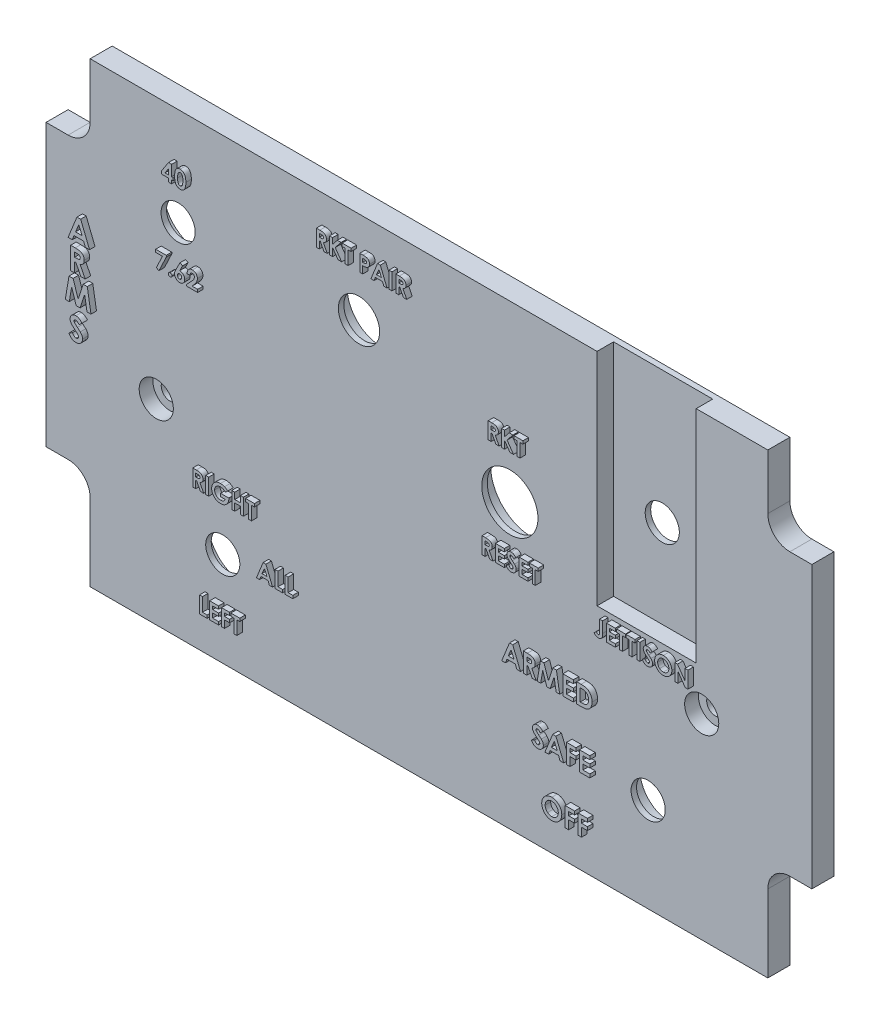
from build123d import *

# Parameters (mm, degrees)
SKETCH1_R            = 1.6
SKETCH1_R_2          = 3.1
SKETCH1_R_3          = 5.1
SKETCH1_R_4          = 3.75
BOSS_EXTRUDE1_DEPTH  = 4
SKETCH5_R            = 5.5
SKETCH5_R_2          = 3.1
SKETCH5_R_3          = 6.15
SKETCH5_R_4          = 3.75
SKETCH5_R_5          = 7.5
SKETCH5_R_6          = 6.75
BACK_HOLES_DEPTH     = 3
SKETCH6_R            = 3.1
CAMA_TORNILLOS_DEPTH = 2.5
SKETCH4_W            = 0.538461539
SKETCH4_H            = 3
SKETCH4_W_2          = 0.538461538
TEXTOS_DEPTH         = 1
SKETCH8_W            = 18.000372339
SKETCH8_H            = 40
CUT_EXTRUDE3_DEPTH   = 3


with BuildPart() as part:
    # Sketch1 → Boss-Extrude1 (new body)
    with BuildSketch(Plane.XY):
        with BuildLine():
            Line((8, 6.645362503), (131, 6.645362503))
            Line((131, 6.645362503), (131, 20.645362503))
            ThreePointArc((131, 20.645362503), (132.171572875, 23.473789627), (135, 24.645362503))
            Line((135, 24.645362503), (139, 24.645362503))
            Line((139, 24.645362503), (139, 75.645362503))
            Line((139, 75.645362503), (135, 75.645362503))
            ThreePointArc((135, 75.645362503), (132.171572875, 76.816935378), (131, 79.645362503))
            Line((131, 79.645362503), (131, 89.645362503))
            Line((131, 89.645362503), (8, 89.645362503))
            Line((8, 89.645362503), (8, 79.645362503))
            ThreePointArc((8, 79.645362503), (6.828427125, 76.816935378), (4, 75.645362503))
            Line((4, 75.645362503), (0, 75.645362503))
            Line((0, 75.645362503), (0, 24.645362503))
            Line((0, 24.645362503), (4, 24.645362503))
            ThreePointArc((4, 24.645362503), (6.828427125, 23.473789627), (8, 20.645362503))
            Line((8, 20.645362503), (8, 6.645362503))
        make_face()
        with Locations((119, 42.17362973)):
            Circle(SKETCH1_R, mode=Mode.SUBTRACT)
        with Locations((109.281287349, 23.745748032)):
            Circle(SKETCH1_R_2, mode=Mode.SUBTRACT)
        with Locations((108.842722678, 65.645362503)):
            Circle(SKETCH1_R_2, mode=Mode.SUBTRACT)
        with Locations((84.178955025, 58.025965012)):
            Circle(SKETCH1_R_3, mode=Mode.SUBTRACT)
        with Locations((56.797589152, 72.972828616)):
            Circle(SKETCH1_R_4, mode=Mode.SUBTRACT)
        with Locations((32.070123038, 23.745748032)):
            Circle(SKETCH1_R_2, mode=Mode.SUBTRACT)
        with Locations((20, 42.17362973)):
            Circle(SKETCH1_R, mode=Mode.SUBTRACT)
        with Locations((23.966882531, 71.893095658)):
            Circle(SKETCH1_R_2, mode=Mode.SUBTRACT)
    extrude(amount=BOSS_EXTRUDE1_DEPTH)

    # Sketch5 → Back Holes (cut)
    # profile 1 of 5: a face of its own
    with BuildSketch(Plane(origin=(0, 0, 0), x_dir=(-1, 0, 0), z_dir=(0, 0, -1))):
        with Locations((-109.281287349, 23.745748032)):
            Circle(SKETCH5_R)
        with Locations((-109.281287349, 23.745748032)):
            Circle(SKETCH5_R_2, mode=Mode.SUBTRACT)
    # profile 2 of 5: a face of its own
    with BuildSketch(Plane(origin=(0, 0, 0), x_dir=(-1, 0, 0), z_dir=(0, 0, -1))):
        with Locations((-56.797589152, 72.972828616)):
            Circle(SKETCH5_R_3)
        with Locations((-56.797589152, 72.972828616)):
            Circle(SKETCH5_R_4, mode=Mode.SUBTRACT)
    # profile 3 of 5: a face of its own
    with BuildSketch(Plane(origin=(0, 0, 0), x_dir=(-1, 0, 0), z_dir=(0, 0, -1))):
        with Locations((-84.178955025, 58.025965012)):
            Circle(SKETCH5_R_5)
    # profile 4 of 5: a face of its own
    with BuildSketch(Plane(origin=(0, 0, 0), x_dir=(-1, 0, 0), z_dir=(0, 0, -1))):
        with Locations((-23.966882531, 71.893095658)):
            Circle(SKETCH5_R_6)
        with Locations((-23.966882531, 71.893095658)):
            Circle(SKETCH5_R_2, mode=Mode.SUBTRACT)
    # profile 5 of 5: a face of its own
    with BuildSketch(Plane(origin=(0, 0, 0), x_dir=(-1, 0, 0), z_dir=(0, 0, -1))):
        with Locations((-32.070123038, 23.745748032)):
            Circle(SKETCH5_R_6)
        with Locations((-32.070123038, 23.745748032)):
            Circle(SKETCH5_R_2, mode=Mode.SUBTRACT)
    extrude(amount=-BACK_HOLES_DEPTH, mode=Mode.SUBTRACT)

    # Sketch6 → Cama tornillos (cut)
    with BuildSketch(Plane.XY.offset(4)):
        with Locations((20, 42.17362973)):
            Circle(SKETCH6_R)
        with Locations((119, 42.17362973)):
            Circle(SKETCH6_R)
    extrude(amount=-CAMA_TORNILLOS_DEPTH, mode=Mode.SUBTRACT)

    # Sketch4 → Textos (add)
    # profile 1 of 57: a face of its own
    with BuildSketch(Plane.XY.offset(4)):
        Polygon((6.607732474, 64.566037828), (7.275200422, 64.566037828), (8.890585038, 60.566037828), (8.123758115, 60.566037828), (7.812860679, 61.386550649), (6.071674781, 61.386550649), (5.759976063, 60.566037828), (4.99314914, 60.566037828), align=None)
        Polygon((6.941867089, 63.493121162), (6.344110679, 62.104499367), (7.540424781, 62.104499367), align=None, mode=Mode.SUBTRACT)
    # profile 2 of 57: a face of its own
    with BuildSketch(Plane.XY.offset(4)):
        Polygon((20.891445691, 66.65098981), (22.814522614, 66.65098981), (22.814522614, 66.371542695), (21.491205306, 63.574066733), (21.014642806, 63.814451349), (22.119811075, 66.15098981), (20.891445691, 66.15098981), align=None)
    # profile 3 of 57: a face of its own
    with BuildSketch(Plane.XY.offset(4)):
        with BuildLine():
            add(Edge.make_bspline(
                [(23.526061075, 64.266374425), (23.547798129, 64.265182635), (23.590594634, 64.262836205), (23.652429748, 64.245325047), (23.708236295, 64.213863757), (23.758134805, 64.172827956), (23.800327728, 64.123456409), (23.830823818, 64.067154196), (23.849814499, 64.005557341), (23.851911083, 63.962626193), (23.852984152, 63.940653272)],
                knots=[0, 0, 0, 0, 1.016957001, 2.002212695, 2.9757545, 3.99499976, 5.013036768, 5.994806404, 6.97370641, 8, 8, 8, 8], degree=3))
            add(Edge.make_bspline(
                [(23.852984152, 63.940653272), (23.851918113, 63.918676821), (23.849835263, 63.875738778), (23.830692404, 63.814021897), (23.800373298, 63.757256931), (23.758131419, 63.707356336), (23.708442942, 63.665547177), (23.652301439, 63.634376006), (23.590712429, 63.615871484), (23.547818862, 63.613653397), (23.526061075, 63.612528272)],
                knots=[0, 0, 0, 0, 1.023218912, 1.999186227, 2.986238111, 4.008388923, 5.030539734, 6.0011649, 6.986089706, 8, 8, 8, 8], degree=3))
            add(Edge.make_bspline(
                [(23.526061075, 63.612528272), (23.504298133, 63.613644248), (23.461394403, 63.615844298), (23.399709656, 63.634531981), (23.343153673, 63.665339066), (23.293452712, 63.70740705), (23.251022115, 63.757080229), (23.221565009, 63.814201001), (23.20224384, 63.87571551), (23.200189464, 63.918668944), (23.199137998, 63.940653272)],
                knots=[0, 0, 0, 0, 1.013427518, 1.99788335, 2.976245624, 3.997909735, 5.019573847, 6.001765691, 6.977268297, 8, 8, 8, 8], degree=3))
            add(Edge.make_bspline(
                [(23.199137998, 63.940653272), (23.200196401, 63.962634208), (23.20226433, 64.005581014), (23.221433969, 64.06697303), (23.251069325, 64.123634072), (23.293449173, 64.172777136), (23.343361385, 64.214070243), (23.399580627, 64.24517121), (23.461512138, 64.262863592), (23.504318841, 64.26519186), (23.526061075, 64.266374425)],
                knots=[0, 0, 0, 0, 1.025808215, 2.00424526, 2.981110158, 3.998665696, 5.017428914, 5.998734231, 6.983523959, 8, 8, 8, 8], degree=3))
        make_face()
    # profile 4 of 57: a face of its own
    with BuildSketch(Plane.XY.offset(4)):
        with BuildLine():
            Line((25.302503383, 66.727912887), (25.779666844, 66.485725387))
            Line((25.779666844, 66.485725387), (25.256830306, 65.458682118))
            add(Edge.make_bspline(
                [(25.256830306, 65.458682118), (25.287720643, 65.457894704), (25.348365848, 65.456348821), (25.437661971, 65.44350434), (25.52305064, 65.421573461), (25.605552834, 65.392393489), (25.683973661, 65.35321654), (25.759574549, 65.306610582), (25.83040009, 65.249770423), (25.898074135, 65.186794333), (25.959609803, 65.117025934), (26.013064408, 65.042057558), (26.059649153, 64.963713212), (26.095862259, 64.880240139), (26.125072956, 64.793022001), (26.146149759, 64.70171015), (26.158174665, 64.606040166), (26.159832499, 64.541047212), (26.16067646, 64.507960964)],
                knots=[0, 0, 0, 0, 1.013672955, 1.990085268, 2.953345895, 3.903887042, 4.856677135, 5.825509993, 6.813434118, 7.832212698, 8.85718992, 9.860832204, 10.8510077, 11.84312444, 12.841215551, 13.86684641, 14.914066156, 16, 16, 16, 16], degree=3))
            add(Edge.make_bspline(
                [(26.16067646, 64.507960964), (26.159885599, 64.476067828), (26.158322405, 64.413028775), (26.145400544, 64.320440438), (26.124518138, 64.231607343), (26.094672985, 64.146706902), (26.056737383, 64.065324117), (26.010344711, 63.987506746), (25.955110231, 63.913836292), (25.892461052, 63.844704205), (25.82397469, 63.781689796), (25.751786336, 63.725678922), (25.675284272, 63.679411815), (25.595914478, 63.640338159), (25.512215707, 63.611180747), (25.425440516, 63.589171951), (25.334930863, 63.576471921), (25.273495229, 63.574874878), (25.242407229, 63.574066733)],
                knots=[0, 0, 0, 0, 1.049934834, 2.075270938, 3.072134561, 4.05064612, 5.033440221, 6.024524368, 7.028587226, 8.060776465, 9.092543989, 10.090062252, 11.064205434, 12.031961459, 12.998029633, 13.977230324, 14.976426867, 16, 16, 16, 16], degree=3))
            add(Edge.make_bspline(
                [(25.242407229, 63.574066733), (25.209898628, 63.574729935), (25.145974863, 63.576034031), (25.052438396, 63.590636468), (24.962728875, 63.612618401), (24.87735048, 63.644004867), (24.79577227, 63.683969578), (24.718954679, 63.733421888), (24.646250628, 63.791816471), (24.578435247, 63.85783954), (24.517338642, 63.93015878), (24.462845577, 64.005244979), (24.416744373, 64.083215965), (24.379426524, 64.163988372), (24.350310272, 64.247304815), (24.3300513, 64.333323422), (24.316850709, 64.421816028), (24.315303241, 64.481872118), (24.314522614, 64.512167695)],
                knots=[0, 0, 0, 0, 1.063775006, 2.091769615, 3.092589432, 4.084662827, 5.064601646, 6.061867366, 7.070035304, 8.113879863, 9.156342271, 10.166834137, 11.149076039, 12.117706134, 13.076241869, 14.034148791, 15.008317125, 16, 16, 16, 16], degree=3))
            add(Edge.make_bspline(
                [(24.314522614, 64.512167695), (24.314935082, 64.535628075), (24.315762314, 64.582679425), (24.324075506, 64.653136266), (24.336714478, 64.723778049), (24.351364701, 64.783387822), (24.366450021, 64.833794124), (24.381633511, 64.876451615), (24.400450102, 64.923792102), (24.421960252, 64.975936475), (24.446840378, 65.032822003), (24.474960511, 65.094293631), (24.506390656, 65.160816869), (24.528804678, 65.206508033), (24.540484152, 65.230316733)],
                knots=[0, 0, 0, 0, 1.110454016, 2.227089276, 3.35462975, 4.507227546, 5.131400587, 5.845402449, 6.650387134, 7.543487832, 8.516250726, 9.590168902, 10.744287919, 12, 12, 12, 12], degree=3))
            Line((24.540484152, 65.230316733), (25.302503383, 66.727912887))
        make_face()
        with BuildLine():
            add(Edge.make_bspline(
                [(25.230387998, 64.958682118), (25.204550975, 64.957497028), (25.153991311, 64.955177963), (25.082103031, 64.930891586), (25.01655723, 64.892792305), (24.959741319, 64.839731689), (24.912220038, 64.776322168), (24.877299732, 64.70399514), (24.856293228, 64.623715789), (24.854110787, 64.567585805), (24.852984152, 64.538610002)],
                knots=[0, 0, 0, 0, 0.981744412, 1.921144944, 2.858899012, 3.85339082, 4.86292663, 5.863643845, 6.897155691, 8, 8, 8, 8], degree=3))
            add(Edge.make_bspline(
                [(24.852984152, 64.538610002), (24.854318123, 64.509624551), (24.856912785, 64.453245911), (24.878709161, 64.372202157), (24.914396593, 64.298232666), (24.964445939, 64.233982831), (25.023203153, 64.180650494), (25.088357933, 64.141208681), (25.158823476, 64.116978281), (25.207566213, 64.114021851), (25.232190883, 64.112528272)],
                knots=[0, 0, 0, 0, 1.098279937, 2.136227893, 3.159405121, 4.194678092, 5.206500211, 6.154139736, 7.067477469, 8, 8, 8, 8], degree=3))
            add(Edge.make_bspline(
                [(25.232190883, 64.112528272), (25.258197318, 64.114048452), (25.309200454, 64.11702979), (25.382775822, 64.14024062), (25.449987363, 64.179021653), (25.509415365, 64.232183242), (25.56046289, 64.2956999), (25.595782621, 64.370103877), (25.618586654, 64.451732576), (25.620978383, 64.509001573), (25.622214921, 64.538610002)],
                knots=[0, 0, 0, 0, 0.96921794, 1.900804717, 2.848419905, 3.844199796, 4.861108892, 5.867439427, 6.897452859, 8, 8, 8, 8], degree=3))
            add(Edge.make_bspline(
                [(25.622214921, 64.538610002), (25.620806278, 64.567568886), (25.618078275, 64.623651146), (25.597587743, 64.704306587), (25.561003282, 64.77635484), (25.512406793, 64.839993433), (25.45363558, 64.89303039), (25.385466502, 64.931192049), (25.310294246, 64.955134936), (25.25741176, 64.957482484), (25.230387998, 64.958682118)],
                knots=[0, 0, 0, 0, 1.083229974, 2.097801324, 3.086792542, 4.086858909, 5.079819718, 6.026392613, 6.991456328, 8, 8, 8, 8], degree=3))
        make_face(mode=Mode.SUBTRACT)
    # profile 5 of 57: a face of its own
    with BuildSketch(Plane.XY.offset(4)):
        with BuildLine():
            Line((27.122214921, 65.65098981), (26.583753383, 65.65098981))
            add(Edge.make_bspline(
                [(26.583753383, 65.65098981), (26.586078916, 65.691721577), (26.590622867, 65.771309003), (26.608697558, 65.886912289), (26.632917023, 65.996144681), (26.665241114, 66.098624074), (26.705858449, 66.19431323), (26.75372384, 66.283538357), (26.810060139, 66.365829684), (26.873668324, 66.440790356), (26.943468503, 66.508038266), (27.018011556, 66.567664488), (27.098437719, 66.616866546), (27.18327754, 66.657355285), (27.272516573, 66.689703905), (27.366999159, 66.711331576), (27.465907218, 66.725978046), (27.533617793, 66.727259671), (27.568128383, 66.727912887)],
                knots=[0, 0, 0, 0, 1.199038563, 2.342849363, 3.436047546, 4.486744587, 5.497670872, 6.488682221, 7.459191391, 8.424610317, 9.374430501, 10.305433194, 11.225809216, 12.140057399, 13.06607119, 14.010487599, 14.985989317, 16, 16, 16, 16], degree=3))
            add(Edge.make_bspline(
                [(27.568128383, 66.727912887), (27.610489642, 66.726591104), (27.693188748, 66.724010674), (27.813357109, 66.701998749), (27.925581219, 66.665180402), (28.029779502, 66.613735462), (28.1250649, 66.548380058), (28.211421611, 66.470454435), (28.286238072, 66.378323673), (28.34998864, 66.275821182), (28.402957743, 66.16728547), (28.440076284, 66.055055043), (28.464473902, 65.942108042), (28.467076059, 65.866055248), (28.468368767, 65.828273464)],
                knots=[0, 0, 0, 0, 1.075374347, 2.099382735, 3.09057751, 4.06680945, 5.040638231, 6.016817125, 7.011024321, 8.044445721, 9.0776792, 10.070479129, 11.0414456, 12, 12, 12, 12], degree=3))
            add(Edge.make_bspline(
                [(28.468368767, 65.828273464), (28.467865455, 65.805420371), (28.466852411, 65.759422739), (28.459808582, 65.689817034), (28.449241446, 65.618915484), (28.433308781, 65.546778883), (28.413439441, 65.473387009), (28.389335059, 65.398520225), (28.360436512, 65.322602998), (28.327226056, 65.244780894), (28.287605899, 65.164801254), (28.241473733, 65.081465152), (28.187605105, 64.994846514), (28.126650682, 64.904456263), (28.058314423, 64.810436959), (27.982262731, 64.713071816), (27.899371544, 64.612017751), (27.840541337, 64.54446878), (27.810315883, 64.509763849)],
                knots=[0, 0, 0, 0, 0.728284026, 1.46585585, 2.227944881, 3.01186502, 3.81876927, 4.650621989, 5.517437689, 6.406905708, 7.346299482, 8.360816762, 9.441613733, 10.596154504, 11.834900912, 13.145207542, 14.533280747, 16, 16, 16, 16], degree=3))
            Line((27.810315883, 64.509763849), (27.497214921, 64.15098981))
            Line((27.497214921, 64.15098981), (28.506830306, 64.15098981))
            Line((28.506830306, 64.15098981), (28.506830306, 63.65098981))
            Line((28.506830306, 63.65098981), (26.506830306, 63.65098981))
            Line((26.506830306, 63.65098981), (26.506830306, 63.923826349))
            Line((26.506830306, 63.923826349), (27.39505146, 64.869138849))
            add(Edge.make_bspline(
                [(27.39505146, 64.869138849), (27.420767745, 64.896713908), (27.470572562, 64.95011862), (27.541439685, 65.028549121), (27.605568171, 65.102977795), (27.661628264, 65.174197156), (27.712561926, 65.239897138), (27.756098028, 65.302058022), (27.792634892, 65.360117849), (27.83230084, 65.43012786), (27.869970451, 65.513627257), (27.904534599, 65.609821986), (27.925603839, 65.701761993), (27.928512061, 65.761672078), (27.929907229, 65.790412887)],
                knots=[0, 0, 0, 0, 1.246127091, 2.413378631, 3.493388633, 4.492180848, 5.408488754, 6.240484944, 6.999099869, 7.674939598, 8.898438119, 10.020720584, 11.050475521, 12, 12, 12, 12], degree=3))
            add(Edge.make_bspline(
                [(27.929907229, 65.790412887), (27.928864096, 65.818217403), (27.926842857, 65.872093109), (27.904631086, 65.948731015), (27.870219839, 66.018118816), (27.821729533, 66.078183125), (27.762992585, 66.127541951), (27.695116524, 66.164253658), (27.61865474, 66.185436146), (27.565053572, 66.188087436), (27.537479344, 66.189451349)],
                knots=[0, 0, 0, 0, 1.062038974, 2.057870785, 3.028805853, 4.01125022, 4.991535629, 5.949134679, 6.94496649, 8, 8, 8, 8], degree=3))
            add(Edge.make_bspline(
                [(27.537479344, 66.189451349), (27.523234147, 66.188947503), (27.495190188, 66.187955602), (27.453967761, 66.181352786), (27.41474166, 66.169716013), (27.377075276, 66.154124374), (27.341370596, 66.133457545), (27.307717678, 66.107982386), (27.275761945, 66.078346278), (27.245649961, 66.044641889), (27.218244123, 66.007027782), (27.193902359, 65.965847483), (27.173775772, 65.921126556), (27.156055594, 65.873455383), (27.142388944, 65.822321939), (27.132437928, 65.768032251), (27.124872835, 65.710674641), (27.12311701, 65.671246678), (27.122214921, 65.65098981)],
                knots=[0, 0, 0, 0, 0.903469896, 1.778625579, 2.63899355, 3.493148037, 4.358286772, 5.247621495, 6.164656832, 7.118446693, 8.109501108, 9.111810964, 10.146451449, 11.215617525, 12.33435995, 13.498009769, 14.714554818, 16, 16, 16, 16], degree=3))
        make_face()
    # profile 6 of 57: a face of its own
    with BuildSketch(Plane.XY.offset(4)):
        with BuildLine():
            Line((27.628159589, 35.635642408), (28.255563435, 35.635642408))
            add(Edge.make_bspline(
                [(28.255563435, 35.635642408), (28.297034638, 35.635495209), (28.376795444, 35.635212104), (28.491806169, 35.630745456), (28.597459337, 35.624529748), (28.693911376, 35.615044413), (28.781121023, 35.602468006), (28.859175683, 35.587642502), (28.928073073, 35.570745662), (28.988394248, 35.549690867), (29.042831125, 35.525941377), (29.093573863, 35.498652777), (29.141741922, 35.468128935), (29.18701335, 35.433566686), (29.229781567, 35.395587796), (29.270127258, 35.354154036), (29.307480299, 35.308914064), (29.341609401, 35.26015374), (29.37271533, 35.208858997), (29.400206447, 35.154959407), (29.422562269, 35.098417487), (29.442316035, 35.04005039), (29.456544032, 34.979023746), (29.466439396, 34.915931661), (29.473684394, 34.850552043), (29.474100947, 34.806136033), (29.474313435, 34.783478947)],
                knots=[0, 0, 0, 0, 1.749336639, 3.364467119, 4.854658419, 6.213483162, 7.451590619, 8.570285859, 9.5643256, 10.440900261, 11.26203566, 12.067320669, 12.869050712, 13.665104639, 14.467235401, 15.27997916, 16.102287765, 16.939272006, 17.78853747, 18.631303466, 19.488103222, 20.351255419, 21.228522269, 22.127379805, 23.044756219, 24, 24, 24, 24], degree=3))
            add(Edge.make_bspline(
                [(29.474313435, 34.783478947), (29.473761468, 34.759830154), (29.47267916, 34.713459181), (29.466849261, 34.645344003), (29.456194037, 34.580176166), (29.440055151, 34.518146472), (29.421505598, 34.45848289), (29.39683945, 34.40228625), (29.369001264, 34.348739254), (29.335938664, 34.298599343), (29.299654076, 34.250752811), (29.257455863, 34.207032835), (29.212077822, 34.165089632), (29.160969087, 34.127550383), (29.106382579, 34.091876818), (29.047233722, 34.059547068), (28.98390854, 34.029748438), (28.939387802, 34.013130663), (28.916621127, 34.004632793)],
                knots=[0, 0, 0, 0, 1.099860209, 2.156625411, 3.176576793, 4.16617041, 5.135385252, 6.078461593, 7.016046972, 7.938469504, 8.868247731, 9.803980173, 10.76021508, 11.73834243, 12.748633912, 13.790971185, 14.870363756, 16, 16, 16, 16], degree=3))
            Line((28.916621127, 34.004632793), (29.60892882, 32.635642408))
            Line((29.60892882, 32.635642408), (29.010371127, 32.635642408))
            Line((29.010371127, 32.635642408), (28.349313435, 33.943334716))
            Line((28.349313435, 33.943334716), (28.166621127, 33.943334716))
            Line((28.166621127, 33.943334716), (28.166621127, 32.635642408))
            Line((28.166621127, 32.635642408), (27.628159589, 32.635642408))
            Line((27.628159589, 32.635642408), (27.628159589, 35.635642408))
        make_face()
        with BuildLine():
            Line((28.166621127, 34.481796255), (28.376356704, 34.481796255))
            add(Edge.make_bspline(
                [(28.376356704, 34.481796255), (28.401998622, 34.482085051), (28.451097385, 34.482638034), (28.521707854, 34.485203), (28.585839, 34.4913833), (28.643766223, 34.499191877), (28.695781008, 34.508208008), (28.741419402, 34.52112867), (28.781384621, 34.534973487), (28.815203078, 34.552179003), (28.84409679, 34.571745407), (28.869044661, 34.593973327), (28.889680128, 34.619699315), (28.906664169, 34.648224249), (28.919875907, 34.679800424), (28.929519463, 34.714081207), (28.934908785, 34.751457098), (28.935528845, 34.777251553), (28.935851897, 34.790690485)],
                knots=[0, 0, 0, 0, 1.688639943, 3.233382647, 4.650958383, 5.928841754, 7.082724185, 8.122798841, 9.049171256, 9.863274652, 10.613301712, 11.341792392, 12.054588806, 12.776240173, 13.521029143, 14.301969904, 15.115324896, 16, 16, 16, 16], degree=3))
            add(Edge.make_bspline(
                [(28.935851897, 34.790690485), (28.935241138, 34.806589723), (28.934041415, 34.83782083), (28.92213644, 34.882782673), (28.903186292, 34.924397935), (28.877210828, 34.962478588), (28.844498109, 34.995862717), (28.806957683, 35.025291093), (28.763779337, 35.048560851), (28.723799438, 35.063909335), (28.687427074, 35.073092491), (28.654602164, 35.079935698), (28.61659072, 35.084785675), (28.573364046, 35.08992994), (28.525032328, 35.093265735), (28.47133213, 35.0957002), (28.412417678, 35.096696259), (28.371348709, 35.097014682), (28.349914397, 35.09718087)],
                knots=[0, 0, 0, 0, 1.020303359, 2.004196876, 2.966617323, 3.9489082, 4.950758222, 5.960522915, 7.003732012, 8.091992268, 8.70421221, 9.413913587, 10.24622431, 11.166358409, 12.212345909, 13.359657661, 14.621978493, 16, 16, 16, 16], degree=3))
            Line((28.349914397, 35.09718087), (28.166621127, 35.09718087))
            Line((28.166621127, 35.09718087), (28.166621127, 34.481796255))
        make_face(mode=Mode.SUBTRACT)
    # profile 7 of 57: a face of its own
    with BuildSketch(Plane.XY.offset(4)):
        with Locations((30.243544205, 34.135642408)):
            Rectangle(SKETCH4_W, SKETCH4_H)
    # profile 8 of 57: a face of its own
    with BuildSketch(Plane.XY.offset(4)):
        with BuildLine():
            Line((33.954481704, 35.158478947), (33.547029781, 34.768454908))
            add(Edge.make_bspline(
                [(33.547029781, 34.768454908), (33.514771102, 34.80075224), (33.451474246, 34.864124936), (33.347960157, 34.946608855), (33.240750977, 35.016736493), (33.129493837, 35.074400342), (33.014033754, 35.119129437), (32.894598583, 35.151125589), (32.770994015, 35.170103049), (32.687319241, 35.172759829), (32.644986512, 35.174103947)],
                knots=[0, 0, 0, 0, 1.075575784, 2.110457258, 3.113929901, 4.09197124, 5.059417775, 6.02750972, 7.002078037, 8, 8, 8, 8], degree=3))
            add(Edge.make_bspline(
                [(32.644986512, 35.174103947), (32.608285331, 35.17316213), (32.536219344, 35.171312789), (32.430325317, 35.157269024), (32.329137088, 35.133809546), (32.232176602, 35.101310356), (32.140035835, 35.059018639), (32.052180907, 35.007587117), (31.969152479, 34.946622334), (31.891604339, 34.877279972), (31.820996508, 34.801572113), (31.759352143, 34.720537933), (31.706844388, 34.635687841), (31.663619796, 34.54658773), (31.630730583, 34.453374352), (31.607251988, 34.356115376), (31.592348918, 34.255093448), (31.590589311, 34.186175243), (31.589698051, 34.151267408)],
                knots=[0, 0, 0, 0, 1.075001177, 2.110859044, 3.123021556, 4.114053297, 5.101481495, 6.087880186, 7.091499647, 8.114004866, 9.131394192, 10.11971144, 11.092043119, 12.050101265, 13.015322563, 13.981809771, 14.977764287, 16, 16, 16, 16], degree=3))
            add(Edge.make_bspline(
                [(31.589698051, 34.151267408), (31.590529376, 34.115151367), (31.5921672, 34.043997821), (31.607900357, 33.939576933), (31.632139993, 33.839116514), (31.667620357, 33.743361958), (31.71128594, 33.65100156), (31.766661093, 33.563824429), (31.831234064, 33.480499276), (31.904889468, 33.402476838), (31.985007527, 33.330558927), (32.071777992, 33.268520685), (32.162560772, 33.214995075), (32.258821107, 33.172604521), (32.358888202, 33.138569551), (32.463777024, 33.114571976), (32.57325139, 33.099849547), (32.647944763, 33.098079284), (32.685851897, 33.09718087)],
                knots=[0, 0, 0, 0, 1.022067601, 2.013613092, 2.983553406, 3.943623673, 4.90013463, 5.87121881, 6.861774014, 7.881098904, 8.905697761, 9.905387765, 10.89678721, 11.884561068, 12.87834324, 13.885584958, 14.926927371, 16, 16, 16, 16], degree=3))
            add(Edge.make_bspline(
                [(32.685851897, 33.09718087), (32.710509083, 33.097403347), (32.758916627, 33.09784012), (32.829922245, 33.104930173), (32.897928572, 33.115066227), (32.963198978, 33.128485159), (33.025074407, 33.147475356), (33.084411566, 33.169682052), (33.140862793, 33.195890382), (33.194122014, 33.227004582), (33.244981882, 33.261879796), (33.292966337, 33.301784457), (33.338917085, 33.345818862), (33.382297195, 33.394520954), (33.422372448, 33.448326186), (33.460426752, 33.506245816), (33.496024393, 33.568854661), (33.517058099, 33.613065856), (33.527799012, 33.635642408)],
                knots=[0, 0, 0, 0, 1.109579412, 2.178351274, 3.208885622, 4.204702371, 5.174744997, 6.119429583, 7.05542196, 7.97267548, 8.893247984, 9.828544973, 10.778894627, 11.756245826, 12.760884819, 13.796418446, 14.874735809, 16, 16, 16, 16], degree=3))
            Line((33.527799012, 33.635642408), (32.666621127, 33.635642408))
            Line((32.666621127, 33.635642408), (32.666621127, 34.174103947))
            Line((32.666621127, 34.174103947), (34.162414397, 34.174103947))
            Line((34.162414397, 34.174103947), (34.166621127, 34.046099139))
            add(Edge.make_bspline(
                [(34.166621127, 34.046099139), (34.166080594, 34.013224257), (34.165000491, 33.94753316), (34.155129487, 33.849730308), (34.138778318, 33.753224607), (34.116424705, 33.658112987), (34.088409973, 33.56392889), (34.052682421, 33.471574208), (34.010845675, 33.380422621), (33.96397057, 33.290861453), (33.911296439, 33.204925078), (33.854585002, 33.123554675), (33.794644721, 33.046891079), (33.730171917, 32.976002405), (33.66217054, 32.910293158), (33.590506727, 32.850016129), (33.514927008, 32.795120316), (33.435831758, 32.745141975), (33.352770454, 32.701338908), (33.266199767, 32.663236051), (33.176250406, 32.630876099), (33.082690143, 32.604347978), (32.985703082, 32.583879422), (32.885287144, 32.569844106), (32.781387182, 32.560306951), (32.710914035, 32.559254936), (32.675034589, 32.558719331)],
                knots=[0, 0, 0, 0, 1.006889344, 2.011981806, 3.007738725, 4.003571281, 5.003404394, 6.015442001, 7.03424805, 8.074616296, 9.110249922, 10.119753985, 11.111721717, 12.089233633, 13.052717867, 14.006597561, 14.955430184, 15.912305663, 16.870361111, 17.829300583, 18.807640451, 19.796414044, 20.806216501, 21.841577364, 22.90109906, 24, 24, 24, 24], degree=3))
            add(Edge.make_bspline(
                [(32.675034589, 32.558719331), (32.636753653, 32.559248251), (32.560869421, 32.560296726), (32.448664412, 32.570116415), (32.339714541, 32.586323178), (32.233992633, 32.608752784), (32.131253221, 32.63666822), (32.03167283, 32.671708696), (31.935455127, 32.71339045), (31.842311985, 32.760609734), (31.753433876, 32.814160514), (31.66901999, 32.873103772), (31.589531072, 32.937818663), (31.514152912, 33.007221846), (31.444646633, 33.083019257), (31.378422009, 33.162753935), (31.318687395, 33.249350229), (31.262874381, 33.340000662), (31.213289653, 33.434667247), (31.169927096, 33.531599077), (31.132947532, 33.630234916), (31.103788252, 33.731034045), (31.080113648, 33.833293608), (31.063174024, 33.937458309), (31.053607427, 34.043515109), (31.052030325, 34.114790772), (31.051236512, 34.150666447)],
                knots=[0, 0, 0, 0, 1.084149091, 2.14910686, 3.187506334, 4.202448172, 5.208724393, 6.201130722, 7.189831603, 8.176984443, 9.156919086, 10.126598231, 11.090766514, 12.05840148, 13.026036446, 14.001772938, 14.991905635, 16.003017641, 17.015720547, 18.016462227, 19.009322657, 19.99686681, 20.986544154, 21.980959929, 22.983742515, 24, 24, 24, 24], degree=3))
            add(Edge.make_bspline(
                [(31.051236512, 34.150666447), (31.052299598, 34.199608534), (31.054398876, 34.296254647), (31.073841384, 34.438614984), (31.104149356, 34.576334406), (31.147644347, 34.708911347), (31.203458693, 34.836528434), (31.270801731, 34.959485254), (31.351136299, 35.077651115), (31.413320772, 35.150812194), (31.44486632, 35.187926062)],
                knots=[0, 0, 0, 0, 1.034044851, 2.041932006, 3.031217818, 4.011390712, 4.986069675, 5.97149666, 6.970960976, 8, 8, 8, 8], degree=3))
            add(Edge.make_bspline(
                [(31.44486632, 35.187926062), (31.464452642, 35.20939756), (31.503331198, 35.25201816), (31.565478499, 35.311240351), (31.629201872, 35.366911401), (31.695383897, 35.417850842), (31.763676668, 35.46517376), (31.834276742, 35.507993052), (31.906813769, 35.547672106), (31.981853448, 35.582184758), (32.059002938, 35.61312823), (32.13860392, 35.639310757), (32.220060201, 35.662502254), (32.304093077, 35.680145035), (32.389853617, 35.694836596), (32.477950577, 35.70468365), (32.568143889, 35.711900839), (32.629146108, 35.712342184), (32.660010551, 35.712565485)],
                knots=[0, 0, 0, 0, 1.020590567, 2.025856924, 3.013483481, 3.991664875, 4.957826714, 5.930500614, 6.890802512, 7.860442893, 8.829981142, 9.809047939, 10.802672283, 11.803273349, 12.823572789, 13.857849586, 14.916166035, 16, 16, 16, 16], degree=3))
            add(Edge.make_bspline(
                [(32.660010551, 35.712565485), (32.692273913, 35.712067929), (32.756466158, 35.711077974), (32.851909396, 35.704228133), (32.946026386, 35.693660442), (33.03842051, 35.677808302), (33.129401843, 35.658259315), (33.218499444, 35.633212224), (33.306294565, 35.604754216), (33.363448856, 35.58206539), (33.391981704, 35.570738562)],
                knots=[0, 0, 0, 0, 1.03180557, 2.052914215, 3.058998889, 4.059601663, 5.049854447, 6.033765722, 7.018406786, 8, 8, 8, 8], degree=3))
            add(Edge.make_bspline(
                [(33.391981704, 35.570738562), (33.415988567, 35.560270534), (33.46481786, 35.538978855), (33.535858465, 35.500024729), (33.60707264, 35.45683961), (33.677691951, 35.407844549), (33.747608792, 35.35313119), (33.817553169, 35.293563721), (33.886811066, 35.228447551), (33.931632697, 35.182103862), (33.954481704, 35.158478947)],
                knots=[0, 0, 0, 0, 0.894392155, 1.819168899, 2.76525314, 3.739198753, 4.75366411, 5.797420238, 6.877176959, 8, 8, 8, 8], degree=3))
        make_face()
    # profile 9 of 57: a face of its own
    with BuildSketch(Plane.XY.offset(4)):
        Polygon((34.705082666, 35.635642408), (35.243544204, 35.635642408), (35.243544204, 34.481796255), (36.282005743, 34.481796255), (36.282005743, 35.635642408), (36.820467281, 35.635642408), (36.820467281, 32.635642408), (36.282005743, 32.635642408), (36.282005743, 33.943334716), (35.243544204, 33.943334716), (35.243544204, 32.635642408), (34.705082666, 32.635642408), align=None)
    # profile 10 of 57: a face of its own
    with BuildSketch(Plane.XY.offset(4)):
        Polygon((37.205082666, 35.635642408), (38.820467281, 35.635642408), (38.820467281, 35.09718087), (38.282005743, 35.09718087), (38.282005743, 32.635642408), (37.743544204, 32.635642408), (37.743544204, 35.09718087), (37.205082666, 35.09718087), align=None)
    # profile 11 of 57: a face of its own
    with BuildSketch(Plane.XY.offset(4)):
        Polygon((40.394666255, 27.14724858), (40.895267217, 27.14724858), (42.106805678, 24.14724858), (41.531685486, 24.14724858), (41.298512409, 24.762633195), (39.992622986, 24.762633195), (39.758848948, 24.14724858), (39.183728755, 24.14724858), align=None)
        Polygon((40.645267217, 26.34256108), (40.196949909, 25.301094734), (41.094185486, 25.301094734), align=None, mode=Mode.SUBTRACT)
    # profile 12 of 57: a face of its own
    with BuildSketch(Plane.XY.offset(4)):
        Polygon((42.549113371, 27.14724858), (43.087574909, 27.14724858), (43.087574909, 24.685710118), (43.933728755, 24.685710118), (43.933728755, 24.14724858), (42.549113371, 24.14724858), align=None)
    # profile 13 of 57: a face of its own
    with BuildSketch(Plane.XY.offset(4)):
        Polygon((44.395267217, 27.14724858), (44.933728755, 27.14724858), (44.933728755, 24.685710118), (45.779882601, 24.685710118), (45.779882601, 24.14724858), (44.395267217, 24.14724858), align=None)
    # profile 14 of 57: a face of its own
    with BuildSketch(Plane.XY.offset(4)):
        with BuildLine():
            Line((81.245806209, 69.870206889), (81.873210056, 69.870206889))
            add(Edge.make_bspline(
                [(81.873210056, 69.870206889), (81.914681259, 69.87005969), (81.994442065, 69.869776585), (82.10945279, 69.865309937), (82.215105958, 69.859094229), (82.311557997, 69.849608894), (82.398767644, 69.837032486), (82.476822303, 69.822206983), (82.545719693, 69.805310143), (82.606040868, 69.784255347), (82.660477746, 69.760505857), (82.711220484, 69.733217258), (82.759388543, 69.702693416), (82.804659971, 69.668131167), (82.847428188, 69.630152277), (82.887773878, 69.588718517), (82.92512692, 69.543478545), (82.959256021, 69.494718221), (82.99036195, 69.443423478), (83.017853068, 69.389523888), (83.04020889, 69.332981968), (83.059962655, 69.274614871), (83.074190652, 69.213588227), (83.084086016, 69.150496141), (83.091331015, 69.085116523), (83.091747568, 69.040700514), (83.091960056, 69.018043427)],
                knots=[0, 0, 0, 0, 1.749336639, 3.364467119, 4.854658419, 6.213483162, 7.451590619, 8.570285859, 9.5643256, 10.440900261, 11.26203566, 12.067320669, 12.869050712, 13.665104639, 14.467235401, 15.27997916, 16.102287765, 16.939272006, 17.78853747, 18.631303466, 19.488103222, 20.351255419, 21.228522269, 22.127379805, 23.044756219, 24, 24, 24, 24], degree=3))
            add(Edge.make_bspline(
                [(83.091960056, 69.018043427), (83.091408088, 68.994394634), (83.09032578, 68.948023661), (83.084495881, 68.879908484), (83.073840658, 68.814740647), (83.057701772, 68.752710953), (83.039152218, 68.693047371), (83.01448607, 68.636850731), (82.986647885, 68.583303734), (82.953585285, 68.533163823), (82.917300697, 68.485317291), (82.875102484, 68.441597315), (82.829724443, 68.399654113), (82.778615708, 68.362114863), (82.7240292, 68.326441299), (82.664880342, 68.294111549), (82.601555161, 68.264312919), (82.557034422, 68.247695144), (82.534267748, 68.239197274)],
                knots=[0, 0, 0, 0, 1.099860209, 2.156625411, 3.176576793, 4.16617041, 5.135385252, 6.078461593, 7.016046972, 7.938469504, 8.868247731, 9.803980173, 10.76021508, 11.73834243, 12.748633912, 13.790971185, 14.870363756, 16, 16, 16, 16], degree=3))
            Line((82.534267748, 68.239197274), (83.22657544, 66.870206889))
            Line((83.22657544, 66.870206889), (82.628017748, 66.870206889))
            Line((82.628017748, 66.870206889), (81.966960056, 68.177899197))
            Line((81.966960056, 68.177899197), (81.784267748, 68.177899197))
            Line((81.784267748, 68.177899197), (81.784267748, 66.870206889))
            Line((81.784267748, 66.870206889), (81.245806209, 66.870206889))
            Line((81.245806209, 66.870206889), (81.245806209, 69.870206889))
        make_face()
        with BuildLine():
            Line((81.784267748, 68.716360735), (81.994003325, 68.716360735))
            add(Edge.make_bspline(
                [(81.994003325, 68.716360735), (82.019645243, 68.716649532), (82.068744005, 68.717202515), (82.139354475, 68.71976748), (82.20348562, 68.72594778), (82.261412844, 68.733756358), (82.313427629, 68.742772488), (82.359066022, 68.755693151), (82.399031242, 68.769537968), (82.432849698, 68.786743484), (82.46174341, 68.806309887), (82.486691281, 68.828537808), (82.507326748, 68.854263796), (82.524310789, 68.882788729), (82.537522527, 68.914364905), (82.547166084, 68.948645687), (82.552555406, 68.986021579), (82.553175465, 69.011816033), (82.553498517, 69.025254966)],
                knots=[0, 0, 0, 0, 1.688639943, 3.233382647, 4.650958383, 5.928841754, 7.082724185, 8.122798841, 9.049171256, 9.863274652, 10.613301712, 11.341792392, 12.054588806, 12.776240173, 13.521029143, 14.301969904, 15.115324896, 16, 16, 16, 16], degree=3))
            add(Edge.make_bspline(
                [(82.553498517, 69.025254966), (82.552887758, 69.041154204), (82.551688036, 69.072385311), (82.539783061, 69.117347154), (82.520832912, 69.158962416), (82.494857449, 69.197043069), (82.46214473, 69.230427198), (82.424604304, 69.259855574), (82.381425957, 69.283125331), (82.341446058, 69.298473815), (82.305073695, 69.307656972), (82.272248784, 69.314500179), (82.23423734, 69.319350156), (82.191010666, 69.32449442), (82.142678949, 69.327830215), (82.08897875, 69.33026468), (82.030064298, 69.33126074), (81.988995329, 69.331579162), (81.967561017, 69.33174535)],
                knots=[0, 0, 0, 0, 1.020303359, 2.004196876, 2.966617323, 3.9489082, 4.950758222, 5.960522915, 7.003732012, 8.091992268, 8.70421221, 9.413913587, 10.24622431, 11.166358409, 12.212345909, 13.359657661, 14.621978493, 16, 16, 16, 16], degree=3))
            Line((81.967561017, 69.33174535), (81.784267748, 69.33174535))
            Line((81.784267748, 69.33174535), (81.784267748, 68.716360735))
        make_face(mode=Mode.SUBTRACT)
    # profile 15 of 57: a face of its own
    with BuildSketch(Plane.XY.offset(4)):
        Polygon((83.668883133, 69.870206889), (84.207344671, 69.870206889), (84.207344671, 68.814317466), (85.058306209, 69.870206889), (85.737993709, 69.870206889), (84.668883133, 68.543283812), (85.841960056, 66.870206889), (85.193522556, 66.870206889), (84.207344671, 68.27705785), (84.207344671, 66.870206889), (83.668883133, 66.870206889), align=None)
    # profile 16 of 57: a face of its own
    with BuildSketch(Plane.XY.offset(4)):
        Polygon((85.938113902, 69.870206889), (87.553498517, 69.870206889), (87.553498517, 69.33174535), (87.015036979, 69.33174535), (87.015036979, 66.870206889), (86.47657544, 66.870206889), (86.47657544, 69.33174535), (85.938113902, 69.33174535), align=None)
    # profile 17 of 57: a face of its own
    with BuildSketch(Plane.XY.offset(4)):
        with BuildLine():
            Line((7.512820513, 48.317546493), (6.975961538, 47.826360595))
            add(Edge.make_bspline(
                [(6.975961538, 47.826360595), (6.952964802, 47.858799883), (6.908814275, 47.921078791), (6.837250876, 48.004471717), (6.766010622, 48.075612089), (6.694433516, 48.134202715), (6.621885126, 48.179887614), (6.548491384, 48.212233027), (6.474668381, 48.232795313), (6.425070719, 48.235355813), (6.400641026, 48.236617005)],
                knots=[0, 0, 0, 0, 1.299362458, 2.494594718, 3.587462134, 4.587049575, 5.512617175, 6.380583204, 7.202344345, 8, 8, 8, 8], degree=3))
            add(Edge.make_bspline(
                [(6.400641026, 48.236617005), (6.377853708, 48.235817856), (6.333857386, 48.234274908), (6.271137364, 48.218938121), (6.215453635, 48.192469078), (6.166860544, 48.157858578), (6.128367647, 48.116160949), (6.097634054, 48.072430858), (6.080328459, 48.024162728), (6.078050702, 47.991010228), (6.076923077, 47.974597775)],
                knots=[0, 0, 0, 0, 1.185010067, 2.2879431, 3.333075148, 4.379039566, 5.372662701, 6.27520591, 7.14612461, 8, 8, 8, 8], degree=3))
            add(Edge.make_bspline(
                [(6.076923077, 47.974597775), (6.077629702, 47.957948646), (6.079052747, 47.924419615), (6.092797426, 47.875278644), (6.113514581, 47.827262194), (6.133310669, 47.798032297), (6.143429487, 47.783091364)],
                knots=[0, 0, 0, 0, 0.967525499, 1.948461899, 2.951351359, 4, 4, 4, 4], degree=3))
            add(Edge.make_bspline(
                [(6.143429487, 47.783091364), (6.152628587, 47.771477934), (6.173803701, 47.744745351), (6.214180306, 47.702405106), (6.264884841, 47.6505346), (6.327868525, 47.590917508), (6.400516732, 47.521409765), (6.486196799, 47.444743748), (6.582442481, 47.358545199), (6.650851681, 47.298519651), (6.686698718, 47.267065723)],
                knots=[0, 0, 0, 0, 0.473873513, 1.090794244, 1.870441696, 2.795289791, 3.865433203, 5.087734844, 6.473946851, 8, 8, 8, 8], degree=3))
            add(Edge.make_bspline(
                [(6.686698718, 47.267065723), (6.720346318, 47.237945422), (6.784202474, 47.182681141), (6.875057102, 47.104242366), (6.954903189, 47.033672914), (7.024903909, 46.972031879), (7.08399812, 46.918672507), (7.132434254, 46.873339741), (7.170803877, 46.836916125), (7.192614761, 46.814916239), (7.201923077, 46.805527262)],
                knots=[0, 0, 0, 0, 1.543621617, 2.929473131, 4.163658386, 5.240097082, 6.164993805, 6.925417477, 7.541396219, 8, 8, 8, 8], degree=3))
            add(Edge.make_bspline(
                [(7.201923077, 46.805527262), (7.237236888, 46.767310155), (7.305122434, 46.693843456), (7.393349713, 46.579993176), (7.465963617, 46.468852088), (7.52213911, 46.358328893), (7.564565102, 46.24682896), (7.594475988, 46.13161776), (7.612389817, 46.011491408), (7.61437867, 45.929519837), (7.615384615, 45.888059313)],
                knots=[0, 0, 0, 0, 1.206664779, 2.319633467, 3.337109185, 4.282041471, 5.190008762, 6.099243693, 7.03861361, 8, 8, 8, 8], degree=3))
            add(Edge.make_bspline(
                [(7.615384615, 45.888059313), (7.614668609, 45.847661117), (7.613263779, 45.768398353), (7.596057302, 45.652409105), (7.571521875, 45.54140236), (7.533585801, 45.436586029), (7.487349539, 45.336239584), (7.429385706, 45.241926104), (7.361315132, 45.152691097), (7.283295803, 45.070129748), (7.196997161, 44.995211047), (7.104433666, 44.928516649), (7.004700185, 44.873451929), (6.898648825, 44.828110059), (6.786336354, 44.793187145), (6.667896569, 44.767375857), (6.543148308, 44.751884328), (6.45784365, 44.750264873), (6.414262821, 44.749437518)],
                knots=[0, 0, 0, 0, 1.043214005, 2.046824704, 3.02475056, 3.976699089, 4.921714032, 5.875962561, 6.831408892, 7.817874052, 8.806269674, 9.781291748, 10.760897367, 11.74438705, 12.757449933, 13.795994037, 14.874007457, 16, 16, 16, 16], degree=3))
            add(Edge.make_bspline(
                [(6.414262821, 44.749437518), (6.38005224, 44.750044437), (6.312295671, 44.751246483), (6.212432733, 44.761060194), (6.116003776, 44.776898478), (6.023117421, 44.799599472), (5.933355198, 44.828364709), (5.846713419, 44.863500344), (5.763790203, 44.905550967), (5.683958113, 44.953651849), (5.607605231, 45.009503309), (5.533766106, 45.071963482), (5.463174177, 45.141993034), (5.395490405, 45.219426348), (5.331147851, 45.304482695), (5.268040352, 45.395977509), (5.208972595, 45.49560881), (5.172483813, 45.565500973), (5.153846154, 45.601200339)],
                knots=[0, 0, 0, 0, 1.016823716, 2.013894106, 2.979844003, 3.91962641, 4.853723003, 5.779685073, 6.695824784, 7.614987388, 8.547259901, 9.504950863, 10.487499108, 11.500346958, 12.559593716, 13.656357062, 14.802919212, 16, 16, 16, 16], degree=3))
            Line((5.153846154, 45.601200339), (5.78525641, 45.980206749))
            add(Edge.make_bspline(
                [(5.78525641, 45.980206749), (5.808569337, 45.939683305), (5.853262209, 45.861996398), (5.92899846, 45.757614194), (6.006586382, 45.668228114), (6.087819739, 45.595418064), (6.171710764, 45.538210479), (6.25866467, 45.49732597), (6.348742548, 45.472018505), (6.410099507, 45.468927879), (6.440705128, 45.467386236)],
                knots=[0, 0, 0, 0, 1.283663364, 2.460892379, 3.537111102, 4.529833553, 5.449777664, 6.316464042, 7.160231139, 8, 8, 8, 8], degree=3))
            add(Edge.make_bspline(
                [(6.440705128, 45.467386236), (6.471835426, 45.468645225), (6.532232739, 45.471087848), (6.618442174, 45.493649616), (6.697482248, 45.529073247), (6.765803904, 45.579617884), (6.823654375, 45.637954077), (6.866351343, 45.702855759), (6.893173866, 45.773077813), (6.896009657, 45.82185867), (6.897435897, 45.846392646)],
                knots=[0, 0, 0, 0, 1.13588714, 2.203786484, 3.234766741, 4.283437687, 5.291419208, 6.222934724, 7.106237994, 8, 8, 8, 8], degree=3))
            add(Edge.make_bspline(
                [(6.897435897, 45.846392646), (6.896118823, 45.869217519), (6.893443312, 45.915584062), (6.873736322, 45.984523655), (6.842928287, 46.053431897), (6.806480208, 46.109952301), (6.769389724, 46.157275303), (6.733922856, 46.198278543), (6.690733593, 46.243579946), (6.639931443, 46.293236496), (6.582187636, 46.347685333), (6.51745353, 46.406921125), (6.444987851, 46.470422075), (6.393768966, 46.513678295), (6.366987179, 46.536296493)],
                knots=[0, 0, 0, 0, 0.916159276, 1.861089862, 2.860218735, 3.940849679, 4.552606315, 5.27541173, 6.11797699, 7.06649574, 8.129236253, 9.306560635, 10.591630461, 12, 12, 12, 12], degree=3))
            add(Edge.make_bspline(
                [(6.366987179, 46.536296493), (6.316073938, 46.579373977), (6.218356017, 46.662052709), (6.080268197, 46.784166592), (5.955838707, 46.898293206), (5.846142254, 47.005843403), (5.749781135, 47.104830982), (5.667407949, 47.196059958), (5.599927604, 47.280234036), (5.528919091, 47.379932599), (5.461446807, 47.501422149), (5.403131606, 47.647588161), (5.365299165, 47.793735626), (5.361060566, 47.891850985), (5.358974359, 47.940142646)],
                knots=[0, 0, 0, 0, 1.345494975, 2.582412109, 3.71882943, 4.751509156, 5.681369928, 6.505683931, 7.230279997, 7.856715994, 8.973648664, 10.023341002, 11.027102913, 12, 12, 12, 12], degree=3))
            add(Edge.make_bspline(
                [(5.358974359, 47.940142646), (5.35984201, 47.974388501), (5.361551375, 48.041856512), (5.376799178, 48.141058392), (5.3995876, 48.236779871), (5.432682931, 48.328671714), (5.475636675, 48.416618822), (5.527802328, 48.501051732), (5.589989924, 48.581193345), (5.660071147, 48.656990531), (5.737282712, 48.726260534), (5.819793081, 48.787398252), (5.907135239, 48.839036058), (5.99877487, 48.881873367), (6.095279827, 48.914662606), (6.195939162, 48.937905253), (6.300897253, 48.951729238), (6.372287481, 48.953608449), (6.408653846, 48.954565723)],
                knots=[0, 0, 0, 0, 1.010766082, 1.991317756, 2.957454644, 3.913069143, 4.869106762, 5.843196583, 6.838735724, 7.860187025, 8.887984031, 9.89767229, 10.887916223, 11.879572884, 12.879850636, 13.892031539, 14.926195476, 16, 16, 16, 16], degree=3))
            add(Edge.make_bspline(
                [(6.408653846, 48.954565723), (6.455782855, 48.952841644), (6.549668852, 48.949407094), (6.688482008, 48.922550037), (6.824068894, 48.880314485), (6.933327348, 48.829361939), (7.02026226, 48.780004183), (7.08688975, 48.734561779), (7.154686807, 48.682505063), (7.224200172, 48.623669991), (7.29413818, 48.556948032), (7.366489503, 48.483927555), (7.440268265, 48.403977492), (7.488212763, 48.346861538), (7.512820513, 48.317546493)],
                knots=[0, 0, 0, 0, 1.282922637, 2.555718331, 3.837320111, 5.142675274, 5.830281639, 6.55870424, 7.337177975, 8.157850921, 9.037902056, 9.96903443, 10.957596896, 12, 12, 12, 12], degree=3))
        make_face()
    # profile 18 of 57: a face of its own
    with BuildSketch(Plane.XY.offset(4)):
        with BuildLine():
            Line((80.132992508, 51.242089728), (80.760396354, 51.242089728))
            add(Edge.make_bspline(
                [(80.760396354, 51.242089728), (80.801867557, 51.241942529), (80.881628363, 51.241659423), (80.996639088, 51.237192775), (81.102292256, 51.230977067), (81.198744295, 51.221491732), (81.285953942, 51.208915325), (81.364008601, 51.194089821), (81.432905991, 51.177192981), (81.493227166, 51.156138186), (81.547664044, 51.132388696), (81.598406782, 51.105100096), (81.646574841, 51.074576255), (81.691846269, 51.040014006), (81.734614486, 51.002035116), (81.774960176, 50.960601355), (81.812313218, 50.915361383), (81.846442319, 50.866601059), (81.877548248, 50.815306316), (81.905039366, 50.761406727), (81.927395188, 50.704864807), (81.947148953, 50.646497709), (81.96137695, 50.585471065), (81.971272314, 50.52237898), (81.978517313, 50.456999362), (81.978933866, 50.412583352), (81.979146354, 50.389926266)],
                knots=[0, 0, 0, 0, 1.749336639, 3.364467119, 4.854658419, 6.213483162, 7.451590619, 8.570285859, 9.5643256, 10.440900261, 11.26203566, 12.067320669, 12.869050712, 13.665104639, 14.467235401, 15.27997916, 16.102287765, 16.939272006, 17.78853747, 18.631303466, 19.488103222, 20.351255419, 21.228522269, 22.127379805, 23.044756219, 24, 24, 24, 24], degree=3))
            add(Edge.make_bspline(
                [(81.979146354, 50.389926266), (81.978594386, 50.366277473), (81.977512078, 50.3199065), (81.97168218, 50.251791323), (81.961026956, 50.186623485), (81.94488807, 50.124593792), (81.926338516, 50.064930209), (81.901672368, 50.008733569), (81.873834183, 49.955186573), (81.840771583, 49.905046662), (81.804486995, 49.85720013), (81.762288782, 49.813480154), (81.716910741, 49.771536951), (81.665802006, 49.733997702), (81.611215498, 49.698324137), (81.55206664, 49.665994388), (81.488741459, 49.636195757), (81.44422072, 49.619577983), (81.421454046, 49.611080112)],
                knots=[0, 0, 0, 0, 1.099860209, 2.156625411, 3.176576793, 4.16617041, 5.135385252, 6.078461593, 7.016046972, 7.938469504, 8.868247731, 9.803980173, 10.76021508, 11.73834243, 12.748633912, 13.790971185, 14.870363756, 16, 16, 16, 16], degree=3))
            Line((81.421454046, 49.611080112), (82.113761738, 48.242089728))
            Line((82.113761738, 48.242089728), (81.515204046, 48.242089728))
            Line((81.515204046, 48.242089728), (80.854146354, 49.549782035))
            Line((80.854146354, 49.549782035), (80.671454046, 49.549782035))
            Line((80.671454046, 49.549782035), (80.671454046, 48.242089728))
            Line((80.671454046, 48.242089728), (80.132992508, 48.242089728))
            Line((80.132992508, 48.242089728), (80.132992508, 51.242089728))
        make_face()
        with BuildLine():
            Line((80.671454046, 50.088243574), (80.881189623, 50.088243574))
            add(Edge.make_bspline(
                [(80.881189623, 50.088243574), (80.906831541, 50.08853237), (80.955930303, 50.089085353), (81.026540773, 50.091650319), (81.090671919, 50.097830619), (81.148599142, 50.105639196), (81.200613927, 50.114655327), (81.24625232, 50.127575989), (81.28621754, 50.141420806), (81.320035996, 50.158626322), (81.348929708, 50.178192726), (81.373877579, 50.200420646), (81.394513046, 50.226146634), (81.411497088, 50.254671568), (81.424708825, 50.286247743), (81.434352382, 50.320528526), (81.439741704, 50.357904418), (81.440361763, 50.383698872), (81.440684815, 50.397137804)],
                knots=[0, 0, 0, 0, 1.688639943, 3.233382647, 4.650958383, 5.928841754, 7.082724185, 8.122798841, 9.049171256, 9.863274652, 10.613301712, 11.341792392, 12.054588806, 12.776240173, 13.521029143, 14.301969904, 15.115324896, 16, 16, 16, 16], degree=3))
            add(Edge.make_bspline(
                [(81.440684815, 50.397137804), (81.440074056, 50.413037043), (81.438874334, 50.44426815), (81.426969359, 50.489229993), (81.40801921, 50.530845255), (81.382043747, 50.568925907), (81.349331028, 50.602310037), (81.311790602, 50.631738412), (81.268612256, 50.65500817), (81.228632356, 50.670356654), (81.192259993, 50.67953981), (81.159435082, 50.686383017), (81.121423638, 50.691232995), (81.078196964, 50.696377259), (81.029865247, 50.699713054), (80.976165048, 50.702147519), (80.917250596, 50.703143578), (80.876181627, 50.703462001), (80.854747315, 50.703628189)],
                knots=[0, 0, 0, 0, 1.020303359, 2.004196876, 2.966617323, 3.9489082, 4.950758222, 5.960522915, 7.003732012, 8.091992268, 8.70421221, 9.413913587, 10.24622431, 11.166358409, 12.212345909, 13.359657661, 14.621978493, 16, 16, 16, 16], degree=3))
            Line((80.854747315, 50.703628189), (80.671454046, 50.703628189))
            Line((80.671454046, 50.703628189), (80.671454046, 50.088243574))
        make_face(mode=Mode.SUBTRACT)
    # profile 19 of 57: a face of its own
    with BuildSketch(Plane.XY.offset(4)):
        Polygon((82.556069431, 51.242089728), (84.171454046, 51.242089728), (84.171454046, 50.703628189), (83.094530969, 50.703628189), (83.094530969, 50.126705112), (84.171454046, 50.126705112), (84.171454046, 49.588243574), (83.094530969, 49.588243574), (83.094530969, 48.780551266), (84.171454046, 48.780551266), (84.171454046, 48.242089728), (82.556069431, 48.242089728), align=None)
    # profile 20 of 57: a face of its own
    with BuildSketch(Plane.XY.offset(4)):
        with BuildLine():
            Line((86.248377123, 50.841248381), (85.845732892, 50.472858958))
            add(Edge.make_bspline(
                [(85.845732892, 50.472858958), (85.82848534, 50.497188424), (85.795372445, 50.543897605), (85.741699895, 50.6064423), (85.688269705, 50.659797579), (85.634586875, 50.703740548), (85.580175582, 50.738004223), (85.525130276, 50.762263282), (85.469763024, 50.777684997), (85.432564778, 50.779605371), (85.414242508, 50.780551266)],
                knots=[0, 0, 0, 0, 1.299362458, 2.494594718, 3.587462134, 4.587049575, 5.512617175, 6.380583204, 7.202344345, 8, 8, 8, 8], degree=3))
            add(Edge.make_bspline(
                [(85.414242508, 50.780551266), (85.39715202, 50.779951904), (85.364154778, 50.778794693), (85.317114761, 50.767292102), (85.275351965, 50.74744032), (85.238907147, 50.721482445), (85.210037474, 50.690209224), (85.186987279, 50.657411656), (85.174008082, 50.621210558), (85.172299765, 50.596346183), (85.171454046, 50.584036843)],
                knots=[0, 0, 0, 0, 1.185010067, 2.2879431, 3.333075148, 4.379039566, 5.372662701, 6.27520591, 7.14612461, 8, 8, 8, 8], degree=3))
            add(Edge.make_bspline(
                [(85.171454046, 50.584036843), (85.171984015, 50.571549996), (85.173051299, 50.546403223), (85.183359808, 50.509547495), (85.198897674, 50.473535158), (85.21374474, 50.451612735), (85.221333854, 50.440407035)],
                knots=[0, 0, 0, 0, 0.967525499, 1.948461899, 2.951351359, 4, 4, 4, 4], degree=3))
            add(Edge.make_bspline(
                [(85.221333854, 50.440407035), (85.228233179, 50.431696962), (85.244114514, 50.411647525), (85.274396968, 50.379892341), (85.312425369, 50.340989462), (85.359663132, 50.296276643), (85.414149287, 50.244145836), (85.478409337, 50.186646323), (85.550593599, 50.121997411), (85.601900499, 50.07697825), (85.628785777, 50.053387804)],
                knots=[0, 0, 0, 0, 0.473873513, 1.090794244, 1.870441696, 2.795289791, 3.865433203, 5.087734844, 6.473946851, 8, 8, 8, 8], degree=3))
            add(Edge.make_bspline(
                [(85.628785777, 50.053387804), (85.654021477, 50.031547579), (85.701913594, 49.990099368), (85.770054565, 49.931270287), (85.82993913, 49.878343197), (85.88243967, 49.832112421), (85.926760328, 49.792092892), (85.963087429, 49.758093317), (85.991864646, 49.730775606), (86.008222809, 49.714275691), (86.015204046, 49.707233958)],
                knots=[0, 0, 0, 0, 1.543621617, 2.929473131, 4.163658386, 5.240097082, 6.164993805, 6.925417477, 7.541396219, 8, 8, 8, 8], degree=3))
            add(Edge.make_bspline(
                [(86.015204046, 49.707233958), (86.041689404, 49.678571128), (86.092603564, 49.623471104), (86.158774023, 49.538083394), (86.213234451, 49.454727578), (86.255366071, 49.371835181), (86.287185565, 49.288210232), (86.309618729, 49.201801832), (86.323054101, 49.111707068), (86.324545741, 49.05022839), (86.3253002, 49.019132997)],
                knots=[0, 0, 0, 0, 1.206664779, 2.319633467, 3.337109185, 4.282041471, 5.190008762, 6.099243693, 7.03861361, 8, 8, 8, 8], degree=3))
            add(Edge.make_bspline(
                [(86.3253002, 49.019132997), (86.324763195, 48.98883435), (86.323709573, 48.929387277), (86.310804715, 48.842395341), (86.292403145, 48.759140282), (86.263951089, 48.680528034), (86.229273892, 48.6052682), (86.185801018, 48.53453309), (86.134748088, 48.467606835), (86.076233591, 48.405685823), (86.011509609, 48.349496797), (85.942086988, 48.299475999), (85.867286877, 48.258177459), (85.787748357, 48.224171057), (85.703514004, 48.197978871), (85.614684165, 48.178620405), (85.52112297, 48.167001758), (85.457144476, 48.165787167), (85.424458854, 48.165166651)],
                knots=[0, 0, 0, 0, 1.043214005, 2.046824704, 3.02475056, 3.976699089, 4.921714032, 5.875962561, 6.831408892, 7.817874052, 8.806269674, 9.781291748, 10.760897367, 11.74438705, 12.757449933, 13.795994037, 14.874007457, 16, 16, 16, 16], degree=3))
            add(Edge.make_bspline(
                [(85.424458854, 48.165166651), (85.398800918, 48.165621839), (85.347983492, 48.166523374), (85.273086288, 48.173883657), (85.20076457, 48.185762371), (85.131099804, 48.202788116), (85.063778136, 48.224362044), (84.998796803, 48.25071377), (84.936604391, 48.282251737), (84.876730323, 48.318327399), (84.819465662, 48.360215994), (84.764086318, 48.407061124), (84.711142371, 48.459583288), (84.660379542, 48.517658273), (84.612122627, 48.581450533), (84.564792002, 48.650071644), (84.520491184, 48.724795119), (84.493124598, 48.777214242), (84.479146354, 48.803988766)],
                knots=[0, 0, 0, 0, 1.016823716, 2.013894106, 2.979844003, 3.91962641, 4.853723003, 5.779685073, 6.695824784, 7.614987388, 8.547259901, 9.504950863, 10.487499108, 11.500346958, 12.559593716, 13.656357062, 14.802919212, 16, 16, 16, 16], degree=3))
            Line((84.479146354, 48.803988766), (84.952704046, 49.088243574))
            add(Edge.make_bspline(
                [(84.952704046, 49.088243574), (84.970188741, 49.05785099), (85.003708395, 48.999585811), (85.060510583, 48.921299157), (85.118701525, 48.854259597), (85.179626543, 48.79965206), (85.242544811, 48.756746371), (85.307760241, 48.726082989), (85.37531865, 48.707102391), (85.421336369, 48.704784421), (85.444290584, 48.703628189)],
                knots=[0, 0, 0, 0, 1.283663364, 2.460892379, 3.537111102, 4.529833553, 5.449777664, 6.316464042, 7.160231139, 8, 8, 8, 8], degree=3))
            add(Edge.make_bspline(
                [(85.444290584, 48.703628189), (85.467638308, 48.704572431), (85.512936292, 48.706404398), (85.577593368, 48.723325724), (85.636873424, 48.749893447), (85.688114666, 48.787801925), (85.731502519, 48.83155407), (85.763525245, 48.880230331), (85.783642138, 48.932896872), (85.785768981, 48.969482515), (85.786838661, 48.987882997)],
                knots=[0, 0, 0, 0, 1.13588714, 2.203786484, 3.234766741, 4.283437687, 5.291419208, 6.222934724, 7.106237994, 8, 8, 8, 8], degree=3))
            add(Edge.make_bspline(
                [(85.786838661, 48.987882997), (85.785850855, 49.005001651), (85.783844222, 49.039776558), (85.76906398, 49.091481254), (85.745957953, 49.143162435), (85.718621894, 49.185552738), (85.690804032, 49.221044989), (85.66420388, 49.251797419), (85.631811933, 49.285773471), (85.59371032, 49.323015884), (85.550402465, 49.363852512), (85.501851886, 49.408279356), (85.447502626, 49.455905068), (85.409088463, 49.488347233), (85.389002123, 49.505310881)],
                knots=[0, 0, 0, 0, 0.916159276, 1.861089862, 2.860218735, 3.940849679, 4.552606315, 5.27541173, 6.11797699, 7.06649574, 8.129236253, 9.306560635, 10.591630461, 12, 12, 12, 12], degree=3))
            add(Edge.make_bspline(
                [(85.389002123, 49.505310881), (85.350817192, 49.537618995), (85.277528751, 49.599628043), (85.173962886, 49.691213456), (85.080640769, 49.776808416), (84.998368429, 49.857471065), (84.926097589, 49.931711749), (84.8643177, 50.00013348), (84.813707441, 50.063264039), (84.760451057, 50.138037961), (84.709846843, 50.229155124), (84.666110443, 50.338779633), (84.637736112, 50.448390232), (84.634557163, 50.521976751), (84.632992508, 50.558195497)],
                knots=[0, 0, 0, 0, 1.345494975, 2.582412109, 3.71882943, 4.751509156, 5.681369928, 6.505683931, 7.230279997, 7.856715994, 8.973648664, 10.023341002, 11.027102913, 12, 12, 12, 12], degree=3))
            add(Edge.make_bspline(
                [(84.632992508, 50.558195497), (84.633643246, 50.583879887), (84.63492527, 50.634480896), (84.646361122, 50.708882306), (84.663452438, 50.780673415), (84.688273936, 50.849592297), (84.720489244, 50.915552628), (84.759613484, 50.978877311), (84.806254181, 51.038983521), (84.858815099, 51.09583141), (84.916723772, 51.147783912), (84.978606549, 51.193637201), (85.044113168, 51.232365555), (85.112842891, 51.264493537), (85.185221609, 51.289085467), (85.26071611, 51.306517452), (85.339434678, 51.316885441), (85.392977349, 51.318294849), (85.420252123, 51.319012804)],
                knots=[0, 0, 0, 0, 1.010766082, 1.991317756, 2.957454644, 3.913069143, 4.869106762, 5.843196583, 6.838735724, 7.860187025, 8.887984031, 9.89767229, 10.887916223, 11.879572884, 12.879850636, 13.892031539, 14.926195476, 16, 16, 16, 16], degree=3))
            add(Edge.make_bspline(
                [(85.420252123, 51.319012804), (85.455598879, 51.317719745), (85.526013378, 51.315143832), (85.630123244, 51.295001039), (85.731813409, 51.263324376), (85.813757249, 51.225109966), (85.878958433, 51.188091649), (85.928929051, 51.154009847), (85.979776843, 51.11496731), (86.031911867, 51.070841005), (86.084365373, 51.020799536), (86.138628866, 50.966034178), (86.193962937, 50.906071631), (86.22992131, 50.863234665), (86.248377123, 50.841248381)],
                knots=[0, 0, 0, 0, 1.282922637, 2.555718331, 3.837320111, 5.142675274, 5.830281639, 6.55870424, 7.337177975, 8.157850921, 9.037902056, 9.96903443, 10.957596896, 12, 12, 12, 12], degree=3))
        make_face()
    # profile 21 of 57: a face of its own
    with BuildSketch(Plane.XY.offset(4)):
        Polygon((86.863761738, 51.242089728), (88.479146354, 51.242089728), (88.479146354, 50.703628189), (87.402223277, 50.703628189), (87.402223277, 50.126705112), (88.479146354, 50.126705112), (88.479146354, 49.588243574), (87.402223277, 49.588243574), (87.402223277, 48.780551266), (88.479146354, 48.780551266), (88.479146354, 48.242089728), (86.863761738, 48.242089728), align=None)
    # profile 22 of 57: a face of its own
    with BuildSketch(Plane.XY.offset(4)):
        Polygon((88.709915584, 51.242089728), (90.3253002, 51.242089728), (90.3253002, 50.703628189), (89.786838661, 50.703628189), (89.786838661, 48.242089728), (89.248377123, 48.242089728), (89.248377123, 50.703628189), (88.709915584, 50.703628189), align=None)
    # profile 23 of 57: a face of its own
    with BuildSketch(Plane.XY.offset(4)):
        with BuildLine():
            Line((50.052786626, 84.542097708), (50.680190472, 84.542097708))
            add(Edge.make_bspline(
                [(50.680190472, 84.542097708), (50.721661675, 84.541950509), (50.801422481, 84.541667404), (50.916433206, 84.537200755), (51.022086374, 84.530985048), (51.118538413, 84.521499713), (51.20574806, 84.508923305), (51.283802719, 84.494097802), (51.352700109, 84.477200962), (51.413021284, 84.456146166), (51.467458162, 84.432396676), (51.5182009, 84.405108077), (51.566368959, 84.374584235), (51.611640387, 84.340021986), (51.654408604, 84.302043096), (51.694754294, 84.260609336), (51.732107336, 84.215369364), (51.766236438, 84.166609039), (51.797342367, 84.115314297), (51.824833484, 84.061414707), (51.847189306, 84.004872787), (51.866943071, 83.94650569), (51.881171069, 83.885479046), (51.891066433, 83.82238696), (51.898311431, 83.757007342), (51.898727984, 83.712591332), (51.898940472, 83.689934246)],
                knots=[0, 0, 0, 0, 1.749336639, 3.364467119, 4.854658419, 6.213483162, 7.451590619, 8.570285859, 9.5643256, 10.440900261, 11.26203566, 12.067320669, 12.869050712, 13.665104639, 14.467235401, 15.27997916, 16.102287765, 16.939272006, 17.78853747, 18.631303466, 19.488103222, 20.351255419, 21.228522269, 22.127379805, 23.044756219, 24, 24, 24, 24], degree=3))
            add(Edge.make_bspline(
                [(51.898940472, 83.689934246), (51.898388504, 83.666285453), (51.897306196, 83.61991448), (51.891476298, 83.551799303), (51.880821074, 83.486631466), (51.864682188, 83.424601772), (51.846132635, 83.36493819), (51.821466487, 83.30874155), (51.793628301, 83.255194553), (51.760565701, 83.205054642), (51.724281113, 83.15720811), (51.6820829, 83.113488134), (51.636704859, 83.071544931), (51.585596124, 83.034005682), (51.531009616, 82.998332118), (51.471860758, 82.966002368), (51.408535577, 82.936203737), (51.364014839, 82.919585963), (51.341248164, 82.911088092)],
                knots=[0, 0, 0, 0, 1.099860209, 2.156625411, 3.176576793, 4.16617041, 5.135385252, 6.078461593, 7.016046972, 7.938469504, 8.868247731, 9.803980173, 10.76021508, 11.73834243, 12.748633912, 13.790971185, 14.870363756, 16, 16, 16, 16], degree=3))
            Line((51.341248164, 82.911088092), (52.033555856, 81.542097708))
            Line((52.033555856, 81.542097708), (51.434998164, 81.542097708))
            Line((51.434998164, 81.542097708), (50.773940472, 82.849790016))
            Line((50.773940472, 82.849790016), (50.591248164, 82.849790016))
            Line((50.591248164, 82.849790016), (50.591248164, 81.542097708))
            Line((50.591248164, 81.542097708), (50.052786626, 81.542097708))
            Line((50.052786626, 81.542097708), (50.052786626, 84.542097708))
        make_face()
        with BuildLine():
            Line((50.591248164, 83.388251554), (50.800983741, 83.388251554))
            add(Edge.make_bspline(
                [(50.800983741, 83.388251554), (50.826625659, 83.38854035), (50.875724421, 83.389093334), (50.946334891, 83.391658299), (51.010466037, 83.397838599), (51.06839326, 83.405647177), (51.120408045, 83.414663307), (51.166046438, 83.42758397), (51.206011658, 83.441428787), (51.239830114, 83.458634303), (51.268723827, 83.478200706), (51.293671698, 83.500428627), (51.314307164, 83.526154615), (51.331291206, 83.554679548), (51.344502943, 83.586255724), (51.3541465, 83.620536506), (51.359535822, 83.657912398), (51.360155882, 83.683706852), (51.360478933, 83.697145785)],
                knots=[0, 0, 0, 0, 1.688639943, 3.233382647, 4.650958383, 5.928841754, 7.082724185, 8.122798841, 9.049171256, 9.863274652, 10.613301712, 11.341792392, 12.054588806, 12.776240173, 13.521029143, 14.301969904, 15.115324896, 16, 16, 16, 16], degree=3))
            add(Edge.make_bspline(
                [(51.360478933, 83.697145785), (51.359868175, 83.713045023), (51.358668452, 83.74427613), (51.346763477, 83.789237973), (51.327813328, 83.830853235), (51.301837865, 83.868933888), (51.269125146, 83.902318017), (51.23158472, 83.931746392), (51.188406374, 83.95501615), (51.148426474, 83.970364634), (51.112054111, 83.979547791), (51.079229201, 83.986390998), (51.041217757, 83.991240975), (50.997991083, 83.996385239), (50.949659365, 83.999721034), (50.895959167, 84.002155499), (50.837044714, 84.003151559), (50.795975746, 84.003469981), (50.774541433, 84.003636169)],
                knots=[0, 0, 0, 0, 1.020303359, 2.004196876, 2.966617323, 3.9489082, 4.950758222, 5.960522915, 7.003732012, 8.091992268, 8.70421221, 9.413913587, 10.24622431, 11.166358409, 12.212345909, 13.359657661, 14.621978493, 16, 16, 16, 16], degree=3))
            Line((50.774541433, 84.003636169), (50.591248164, 84.003636169))
            Line((50.591248164, 84.003636169), (50.591248164, 83.388251554))
        make_face(mode=Mode.SUBTRACT)
    # profile 24 of 57: a face of its own
    with BuildSketch(Plane.XY.offset(4)):
        Polygon((52.475863549, 84.542097708), (53.014325087, 84.542097708), (53.014325087, 83.486208285), (53.865286626, 84.542097708), (54.544974126, 84.542097708), (53.475863549, 83.215174631), (54.648940472, 81.542097708), (54.000502972, 81.542097708), (53.014325087, 82.948948669), (53.014325087, 81.542097708), (52.475863549, 81.542097708), align=None)
    # profile 25 of 57: a face of its own
    with BuildSketch(Plane.XY.offset(4)):
        Polygon((54.745094318, 84.542097708), (56.360478933, 84.542097708), (56.360478933, 84.003636169), (55.822017395, 84.003636169), (55.822017395, 81.542097708), (55.283555856, 81.542097708), (55.283555856, 84.003636169), (54.745094318, 84.003636169), align=None)
    # profile 26 of 57: a face of its own
    with BuildSketch(Plane.XY.offset(4)):
        with BuildLine():
            Line((57.93740201, 84.542097708), (58.538363549, 84.542097708))
            add(Edge.make_bspline(
                [(58.538363549, 84.542097708), (58.577629596, 84.541921945), (58.653382032, 84.541582861), (58.762623277, 84.537471016), (58.863403674, 84.530102339), (58.95570007, 84.52099582), (59.039474513, 84.508228835), (59.114831916, 84.493592487), (59.181787915, 84.475761154), (59.241097541, 84.45459561), (59.294326014, 84.429642259), (59.344697317, 84.40306516), (59.391073054, 84.37134633), (59.435793947, 84.337904289), (59.476303226, 84.299544332), (59.515128103, 84.25881937), (59.550624238, 84.214114285), (59.582956107, 84.165970219), (59.612286094, 84.11527667), (59.637910733, 84.061943011), (59.658696005, 84.005884848), (59.676132264, 83.947464814), (59.690137236, 83.886685454), (59.699459392, 83.823172971), (59.705791469, 83.757370832), (59.706350188, 83.712585855), (59.70663278, 83.689934246)],
                knots=[0, 0, 0, 0, 1.698747864, 3.27724071, 4.728299578, 6.070144658, 7.288476769, 8.393259625, 9.389771311, 10.283485332, 11.113357557, 11.931608583, 12.74405601, 13.541433047, 14.344816069, 15.154114104, 15.974336324, 16.810834471, 17.661136416, 18.50621059, 19.367396281, 20.244825668, 21.142564693, 22.063065223, 23.020325768, 24, 24, 24, 24], degree=3))
            add(Edge.make_bspline(
                [(59.70663278, 83.689934246), (59.706223905, 83.664875311), (59.705420415, 83.615631424), (59.697543627, 83.543445928), (59.684087584, 83.474623592), (59.666501239, 83.408584027), (59.641978333, 83.346413729), (59.613962063, 83.286629296), (59.579493166, 83.2309069), (59.54010694, 83.178549521), (59.497092688, 83.129131468), (59.449429253, 83.084079595), (59.398025122, 83.043086784), (59.343177853, 83.005723428), (59.284681534, 82.972064897), (59.222578373, 82.941796014), (59.156444295, 82.915884872), (59.110390512, 82.902333555), (59.087041433, 82.895463092)],
                knots=[0, 0, 0, 0, 1.102006807, 2.165578795, 3.188629044, 4.184801286, 5.166646146, 6.124351954, 7.085497154, 8.042432466, 9.003981491, 9.963833307, 10.922997304, 11.89326795, 12.880200226, 13.889073926, 14.929769137, 16, 16, 16, 16], degree=3))
            add(Edge.make_bspline(
                [(59.087041433, 82.895463092), (59.071662387, 82.891636761), (59.03834642, 82.883347694), (58.983217645, 82.874932211), (58.91968752, 82.867194692), (58.847550611, 82.860545231), (58.766765329, 82.856025147), (58.677409896, 82.852495162), (58.579443816, 82.849928499), (58.511322078, 82.849837422), (58.475863549, 82.849790016)],
                knots=[0, 0, 0, 0, 0.618981996, 1.340914327, 2.176866532, 3.120127938, 4.170906482, 5.338178032, 6.614476169, 8, 8, 8, 8], degree=3))
            Line((58.475863549, 82.849790016), (58.475863549, 81.542097708))
            Line((58.475863549, 81.542097708), (57.93740201, 81.542097708))
            Line((57.93740201, 81.542097708), (57.93740201, 84.542097708))
        make_face()
        with BuildLine():
            Line((58.475863549, 83.388251554), (58.666368356, 83.388251554))
            add(Edge.make_bspline(
                [(58.666368356, 83.388251554), (58.701033714, 83.388471359), (58.764818486, 83.388875804), (58.851925961, 83.394724314), (58.921927204, 83.403656169), (58.977229485, 83.416466514), (59.020895874, 83.43590791), (59.058555401, 83.458397944), (59.090856939, 83.486835975), (59.118825316, 83.519331291), (59.141185191, 83.556670038), (59.1566906, 83.598244227), (59.166762608, 83.643180339), (59.167692852, 83.674452899), (59.168171241, 83.690535208)],
                knots=[0, 0, 0, 0, 1.8619151, 3.425951444, 4.686033666, 5.651700536, 6.461346321, 7.243864085, 7.999046032, 8.762387399, 9.539336099, 10.322741239, 11.137448474, 12, 12, 12, 12], degree=3))
            add(Edge.make_bspline(
                [(59.168171241, 83.690535208), (59.167697772, 83.704586112), (59.16677913, 83.731848245), (59.160030528, 83.771194264), (59.149275199, 83.80787287), (59.133691141, 83.841501005), (59.113544644, 83.872021528), (59.088981987, 83.899422416), (59.060318357, 83.924290483), (59.038188359, 83.93745353), (59.02694528, 83.944140977)],
                knots=[0, 0, 0, 0, 1.102301479, 2.1387299, 3.123554645, 4.094223062, 5.036071848, 5.982632524, 6.975082478, 8, 8, 8, 8], degree=3))
            add(Edge.make_bspline(
                [(59.02694528, 83.944140977), (59.017421742, 83.948957303), (58.997258462, 83.959154452), (58.962918442, 83.971009383), (58.923290582, 83.981010323), (58.878107351, 83.989311007), (58.827548997, 83.9957532), (58.771624542, 84.000679866), (58.710251686, 84.00266107), (58.667570536, 84.003302171), (58.645334703, 84.003636169)],
                knots=[0, 0, 0, 0, 0.656809284, 1.390599849, 2.23162475, 3.173112763, 4.218524733, 5.370385145, 6.63003504, 8, 8, 8, 8], degree=3))
            Line((58.645334703, 84.003636169), (58.475863549, 84.003636169))
            Line((58.475863549, 84.003636169), (58.475863549, 83.388251554))
        make_face(mode=Mode.SUBTRACT)
    # profile 27 of 57: a face of its own
    with BuildSketch(Plane.XY.offset(4)):
        Polygon((61.16757028, 84.542097708), (61.668171241, 84.542097708), (62.879709703, 81.542097708), (62.30458951, 81.542097708), (62.071416433, 82.157482323), (60.76552701, 82.157482323), (60.531752972, 81.542097708), (59.95663278, 81.542097708), align=None)
        Polygon((61.418171241, 83.737410208), (60.969853933, 82.695943862), (61.86708951, 82.695943862), align=None, mode=Mode.SUBTRACT)
    # profile 28 of 57: a face of its own
    with BuildSketch(Plane.XY.offset(4)):
        with Locations((63.514325087, 83.042097708)):
            Rectangle(SKETCH4_W_2, SKETCH4_H)
    # profile 29 of 57: a face of its own
    with BuildSketch(Plane.XY.offset(4)):
        with BuildLine():
            Line((64.475863549, 84.542097708), (65.103267395, 84.542097708))
            add(Edge.make_bspline(
                [(65.103267395, 84.542097708), (65.144738598, 84.541950509), (65.224499404, 84.541667404), (65.339510129, 84.537200755), (65.445163297, 84.530985048), (65.541615336, 84.521499713), (65.628824983, 84.508923305), (65.706879642, 84.494097802), (65.775777032, 84.477200962), (65.836098207, 84.456146166), (65.890535085, 84.432396676), (65.941277823, 84.405108077), (65.989445882, 84.374584235), (66.03471731, 84.340021986), (66.077485527, 84.302043096), (66.117831217, 84.260609336), (66.155184259, 84.215369364), (66.189313361, 84.166609039), (66.22041929, 84.115314297), (66.247910407, 84.061414707), (66.270266229, 84.004872787), (66.290019995, 83.94650569), (66.304247992, 83.885479046), (66.314143356, 83.82238696), (66.321388354, 83.757007342), (66.321804907, 83.712591332), (66.322017395, 83.689934246)],
                knots=[0, 0, 0, 0, 1.749336639, 3.364467119, 4.854658419, 6.213483162, 7.451590619, 8.570285859, 9.5643256, 10.440900261, 11.26203566, 12.067320669, 12.869050712, 13.665104639, 14.467235401, 15.27997916, 16.102287765, 16.939272006, 17.78853747, 18.631303466, 19.488103222, 20.351255419, 21.228522269, 22.127379805, 23.044756219, 24, 24, 24, 24], degree=3))
            add(Edge.make_bspline(
                [(66.322017395, 83.689934246), (66.321465427, 83.666285453), (66.32038312, 83.61991448), (66.314553221, 83.551799303), (66.303897997, 83.486631466), (66.287759111, 83.424601772), (66.269209558, 83.36493819), (66.24454341, 83.30874155), (66.216705224, 83.255194553), (66.183642624, 83.205054642), (66.147358036, 83.15720811), (66.105159823, 83.113488134), (66.059781782, 83.071544931), (66.008673047, 83.034005682), (65.954086539, 82.998332118), (65.894937682, 82.966002368), (65.8316125, 82.936203737), (65.787091762, 82.919585963), (65.764325087, 82.911088092)],
                knots=[0, 0, 0, 0, 1.099860209, 2.156625411, 3.176576793, 4.16617041, 5.135385252, 6.078461593, 7.016046972, 7.938469504, 8.868247731, 9.803980173, 10.76021508, 11.73834243, 12.748633912, 13.790971185, 14.870363756, 16, 16, 16, 16], degree=3))
            Line((65.764325087, 82.911088092), (66.45663278, 81.542097708))
            Line((66.45663278, 81.542097708), (65.858075087, 81.542097708))
            Line((65.858075087, 81.542097708), (65.197017395, 82.849790016))
            Line((65.197017395, 82.849790016), (65.014325087, 82.849790016))
            Line((65.014325087, 82.849790016), (65.014325087, 81.542097708))
            Line((65.014325087, 81.542097708), (64.475863549, 81.542097708))
            Line((64.475863549, 81.542097708), (64.475863549, 84.542097708))
        make_face()
        with BuildLine():
            Line((65.014325087, 83.388251554), (65.224060664, 83.388251554))
            add(Edge.make_bspline(
                [(65.224060664, 83.388251554), (65.249702582, 83.38854035), (65.298801345, 83.389093334), (65.369411814, 83.391658299), (65.43354296, 83.397838599), (65.491470183, 83.405647177), (65.543484968, 83.414663307), (65.589123361, 83.42758397), (65.629088581, 83.441428787), (65.662907037, 83.458634303), (65.69180075, 83.478200706), (65.716748621, 83.500428627), (65.737384087, 83.526154615), (65.754368129, 83.554679548), (65.767579867, 83.586255724), (65.777223423, 83.620536506), (65.782612745, 83.657912398), (65.783232805, 83.683706852), (65.783555856, 83.697145785)],
                knots=[0, 0, 0, 0, 1.688639943, 3.233382647, 4.650958383, 5.928841754, 7.082724185, 8.122798841, 9.049171256, 9.863274652, 10.613301712, 11.341792392, 12.054588806, 12.776240173, 13.521029143, 14.301969904, 15.115324896, 16, 16, 16, 16], degree=3))
            add(Edge.make_bspline(
                [(65.783555856, 83.697145785), (65.782945098, 83.713045023), (65.781745375, 83.74427613), (65.7698404, 83.789237973), (65.750890252, 83.830853235), (65.724914788, 83.868933888), (65.692202069, 83.902318017), (65.654661643, 83.931746392), (65.611483297, 83.95501615), (65.571503397, 83.970364634), (65.535131034, 83.979547791), (65.502306124, 83.986390998), (65.46429468, 83.991240975), (65.421068006, 83.996385239), (65.372736288, 83.999721034), (65.31903609, 84.002155499), (65.260121637, 84.003151559), (65.219052669, 84.003469981), (65.197618356, 84.003636169)],
                knots=[0, 0, 0, 0, 1.020303359, 2.004196876, 2.966617323, 3.9489082, 4.950758222, 5.960522915, 7.003732012, 8.091992268, 8.70421221, 9.413913587, 10.24622431, 11.166358409, 12.212345909, 13.359657661, 14.621978493, 16, 16, 16, 16], degree=3))
            Line((65.197618356, 84.003636169), (65.014325087, 84.003636169))
            Line((65.014325087, 84.003636169), (65.014325087, 83.388251554))
        make_face(mode=Mode.SUBTRACT)
    # profile 30 of 57: a face of its own
    with BuildSketch(Plane.XY.offset(4)):
        Polygon((23.230006738, 81.450166983), (23.790703853, 81.450166983), (23.790703853, 79.488628521), (24.059934622, 79.488628521), (24.059934622, 78.988628521), (23.790703853, 78.988628521), (23.790703853, 78.373243906), (23.252242314, 78.373243906), (23.252242314, 78.988628521), (21.983011545, 78.988628521), (21.983011545, 79.533700637), align=None)
        Polygon((23.252242314, 79.488628521), (23.252242314, 80.509662175), (22.588179814, 79.488628521), align=None, mode=Mode.SUBTRACT)
    # profile 31 of 57: a face of its own
    with BuildSketch(Plane.XY.offset(4)):
        with BuildLine():
            add(Edge.make_bspline(
                [(25.339381738, 81.450166983), (25.365445511, 81.449780059), (25.416693853, 81.449019263), (25.492173014, 81.440779221), (25.564880315, 81.428330817), (25.635100196, 81.410969634), (25.702327206, 81.387992726), (25.767050639, 81.360489762), (25.828500097, 81.327018153), (25.887459258, 81.289210253), (25.943905411, 81.246406349), (25.996481911, 81.197607689), (26.046148918, 81.143937132), (26.091831324, 81.084583274), (26.134540779, 81.020086003), (26.174136947, 80.950435091), (26.21031671, 80.875289644), (26.243485557, 80.794514055), (26.273145244, 80.706897534), (26.298127563, 80.61143508), (26.319554081, 80.508104894), (26.337639574, 80.396649771), (26.351309283, 80.27692156), (26.360522943, 80.148999804), (26.366845792, 80.013131115), (26.367361819, 79.919926311), (26.36762693, 79.872041983)],
                knots=[0, 0, 0, 0, 0.879237366, 1.728815576, 2.559023295, 3.367336655, 4.166867292, 4.954216142, 5.737608147, 6.525189134, 7.316157332, 8.124696809, 8.942788509, 9.781158001, 10.649253743, 11.551476218, 12.482711956, 13.461909668, 14.496590415, 15.601789533, 16.789733467, 18.056700938, 19.410929216, 20.8549011, 22.384193279, 24, 24, 24, 24], degree=3))
            add(Edge.make_bspline(
                [(26.36762693, 79.872041983), (26.367340417, 79.823558567), (26.366783727, 79.729356161), (26.360785786, 79.592244749), (26.350457047, 79.463394203), (26.337144624, 79.342817855), (26.318910246, 79.230579379), (26.297555254, 79.126388153), (26.272178598, 79.030281944), (26.24154193, 78.942477298), (26.208573855, 78.86155985), (26.172295124, 78.786560918), (26.133338072, 78.717277365), (26.092596254, 78.652663953), (26.047836056, 78.594625453), (26.001236082, 78.541188252), (25.950767285, 78.494387843), (25.898554598, 78.451812342), (25.842685258, 78.415018564), (25.783735432, 78.382839333), (25.720654145, 78.356738155), (25.654591264, 78.334036745), (25.584420732, 78.317739581), (25.511257549, 78.304808317), (25.434275719, 78.297661708), (25.381863388, 78.296775124), (25.355006738, 78.296320829)],
                knots=[0, 0, 0, 0, 1.643780988, 3.193836972, 4.651895693, 6.025988579, 7.305620092, 8.505800249, 9.631074763, 10.672816429, 11.65661981, 12.592235626, 13.49536222, 14.350718032, 15.179365177, 15.97804903, 16.751647189, 17.51006938, 18.259804725, 19.016521909, 19.783502495, 20.571750527, 21.382245291, 22.22305063, 23.089471752, 24, 24, 24, 24], degree=3))
            add(Edge.make_bspline(
                [(25.355006738, 78.296320829), (25.328150812, 78.296783887), (25.275540449, 78.297691012), (25.198350452, 78.304755179), (25.124799542, 78.317791966), (25.054073848, 78.334161862), (24.98666561, 78.356687926), (24.922251609, 78.383570033), (24.861327132, 78.415548481), (24.803723488, 78.452427985), (24.749637353, 78.494718624), (24.698228229, 78.541968053), (24.649609836, 78.594056506), (24.604521779, 78.651567419), (24.562225648, 78.713733139), (24.523162523, 78.781263569), (24.487355881, 78.854060387), (24.453685684, 78.932225064), (24.424430544, 79.017440395), (24.398394828, 79.110467342), (24.377067055, 79.212081363), (24.359913832, 79.322249812), (24.346218709, 79.440739293), (24.336031111, 79.567606997), (24.329999854, 79.702912016), (24.329449003, 79.795913895), (24.329165391, 79.84379679)],
                knots=[0, 0, 0, 0, 0.917216111, 1.796812873, 2.643793957, 3.46689424, 4.273913431, 5.068098542, 5.848489301, 6.620921603, 7.401012384, 8.190319798, 9.003608147, 9.831726257, 10.68377682, 11.569763213, 12.493818149, 13.453288342, 14.474581811, 15.568529029, 16.750744269, 18.018426408, 19.375425659, 20.823733699, 22.36466933, 24, 24, 24, 24], degree=3))
            add(Edge.make_bspline(
                [(24.329165391, 79.84379679), (24.329679127, 79.910326304), (24.330670386, 80.038695856), (24.343232346, 80.224152536), (24.361670117, 80.395575111), (24.388750836, 80.552676833), (24.422235771, 80.696039561), (24.465114973, 80.824718897), (24.513929826, 80.940495407), (24.555526351, 81.009082109), (24.575559622, 81.042114098)],
                knots=[0, 0, 0, 0, 1.288568992, 2.486310467, 3.599230591, 4.627010532, 5.572937695, 6.447898582, 7.252493626, 8, 8, 8, 8], degree=3))
            add(Edge.make_bspline(
                [(24.575559622, 81.042114098), (24.598853355, 81.074564714), (24.644397193, 81.138012061), (24.724031868, 81.221306569), (24.809588957, 81.292544111), (24.902825754, 81.350112517), (25.002267682, 81.395510967), (25.108768499, 81.427575381), (25.221934917, 81.446257603), (25.299648183, 81.448844396), (25.339381738, 81.450166983)],
                knots=[0, 0, 0, 0, 1.058512271, 2.069600068, 3.047294572, 4.004278952, 4.967380941, 5.939006123, 6.946246673, 8, 8, 8, 8], degree=3))
        make_face()
        with BuildLine():
            add(Edge.make_bspline(
                [(25.352602891, 80.911705444), (25.329041024, 80.910588659), (25.282847257, 80.908399166), (25.2158179, 80.889813462), (25.152613401, 80.86110684), (25.104535427, 80.826562908), (25.068549542, 80.793448407), (25.043405946, 80.763480861), (25.01915891, 80.730039239), (24.997742707, 80.691614493), (24.977520221, 80.649587269), (24.957756757, 80.60376679), (24.941555906, 80.553027604), (24.925638999, 80.498233807), (24.911694304, 80.437870496), (24.900011706, 80.371444268), (24.889574332, 80.298523146), (24.882294139, 80.219059368), (24.875506814, 80.133136071), (24.870641339, 80.040561852), (24.868607205, 79.941361686), (24.867960616, 79.873044004), (24.86762693, 79.837787175)],
                knots=[0, 0, 0, 0, 1.076674018, 2.110852608, 3.161083442, 4.239746716, 4.804137807, 5.395870207, 6.026861976, 6.692161227, 7.405688833, 8.16177676, 8.973626916, 9.841385931, 10.773283133, 11.807421078, 12.927755683, 14.143907515, 15.458935494, 16.872852025, 18.386167141, 20, 20, 20, 20], degree=3))
            add(Edge.make_bspline(
                [(24.86762693, 79.837787175), (24.868176137, 79.792110249), (24.869229283, 79.704521357), (24.874745168, 79.57856548), (24.885801301, 79.46393549), (24.899552899, 79.359854497), (24.91886758, 79.266997493), (24.941090371, 79.184485966), (24.968533542, 79.113371737), (25.000249413, 79.052626335), (25.03537617, 79.000950347), (25.073507809, 78.957025525), (25.113346086, 78.918988701), (25.156134482, 78.888091858), (25.201770917, 78.864413941), (25.249874411, 78.847382708), (25.300475533, 78.836957182), (25.33512666, 78.835511496), (25.352602891, 78.834782367)],
                knots=[0, 0, 0, 0, 1.771748488, 3.397459088, 4.888034009, 6.237357457, 7.467047327, 8.564189669, 9.548206622, 10.417051504, 11.216568818, 11.965764335, 12.669334354, 13.348544111, 14.005342236, 14.656555988, 15.322436492, 16, 16, 16, 16], degree=3))
            add(Edge.make_bspline(
                [(25.352602891, 78.834782367), (25.369479394, 78.835281291), (25.402521488, 78.836258123), (25.450704262, 78.846285165), (25.496269316, 78.862586957), (25.539079076, 78.885646987), (25.579286666, 78.914971344), (25.616695576, 78.95068889), (25.651023677, 78.993155648), (25.671023384, 79.024672262), (25.681328853, 79.040912175)],
                knots=[0, 0, 0, 0, 0.992283464, 1.942767638, 2.88273346, 3.832339453, 4.79467288, 5.803907806, 6.868395428, 8, 8, 8, 8], degree=3))
            add(Edge.make_bspline(
                [(25.681328853, 79.040912175), (25.693461807, 79.063103497), (25.718903628, 79.109636898), (25.748344947, 79.188160278), (25.773127008, 79.276721672), (25.794456566, 79.375596693), (25.809044682, 79.485175314), (25.821607951, 79.60476269), (25.827667527, 79.734961013), (25.82865315, 79.82516288), (25.829165391, 79.872041983)],
                knots=[0, 0, 0, 0, 0.710965849, 1.490837728, 2.352621235, 3.297892224, 4.334225155, 5.461620853, 6.680770821, 8, 8, 8, 8], degree=3))
            add(Edge.make_bspline(
                [(25.829165391, 79.872041983), (25.828967524, 79.919328018), (25.828586662, 80.010345565), (25.821598953, 80.14101196), (25.811868035, 80.260354025), (25.79763451, 80.36810532), (25.779320494, 80.464527415), (25.7567484, 80.549614009), (25.730137579, 80.623532791), (25.698580318, 80.686210053), (25.663628691, 80.739477128), (25.626526471, 80.785176146), (25.587116776, 80.824192815), (25.545465511, 80.856673961), (25.500608644, 80.881491993), (25.453402999, 80.899015576), (25.403751801, 80.909616757), (25.369882655, 80.910999818), (25.352602891, 80.911705444)],
                knots=[0, 0, 0, 0, 1.793836731, 3.452829483, 4.963243077, 6.335886805, 7.574563692, 8.684454726, 9.672768357, 10.54971625, 11.340229787, 12.085688095, 12.778991901, 13.440269426, 14.083255152, 14.715733572, 15.344777694, 16, 16, 16, 16], degree=3))
        make_face(mode=Mode.SUBTRACT)
    # profile 32 of 57: a face of its own
    with BuildSketch(Plane.XY.offset(4)):
        with BuildLine():
            Line((5.461538462, 59.566037828), (6.298076923, 59.566037828))
            add(Edge.make_bspline(
                [(6.298076923, 59.566037828), (6.353371861, 59.565841563), (6.459719602, 59.56546409), (6.613067235, 59.559508558), (6.753938126, 59.551220948), (6.882540845, 59.538573835), (6.998820374, 59.521805291), (7.102893253, 59.502037953), (7.19475644, 59.479508834), (7.275184673, 59.451435773), (7.347767176, 59.419769786), (7.415424161, 59.383384987), (7.479648239, 59.342686531), (7.540010143, 59.296603532), (7.597034432, 59.245965012), (7.650828686, 59.190719999), (7.700632742, 59.130400036), (7.746138211, 59.065386271), (7.787612783, 58.99699328), (7.824267606, 58.92512716), (7.854075369, 58.849737934), (7.880413723, 58.771915137), (7.899384386, 58.690546279), (7.912578204, 58.606423498), (7.922238202, 58.519250674), (7.922793606, 58.460029328), (7.923076923, 58.42981988)],
                knots=[0, 0, 0, 0, 1.749336639, 3.364467119, 4.854658419, 6.213483162, 7.451590619, 8.570285859, 9.5643256, 10.440900261, 11.26203566, 12.067320669, 12.869050712, 13.665104639, 14.467235401, 15.27997916, 16.102287765, 16.939272006, 17.78853747, 18.631303466, 19.488103222, 20.351255419, 21.228522269, 22.127379805, 23.044756219, 24, 24, 24, 24], degree=3))
            add(Edge.make_bspline(
                [(7.923076923, 58.42981988), (7.922340966, 58.398288155), (7.920897889, 58.336460191), (7.913124691, 58.245639955), (7.898917726, 58.158749505), (7.877399211, 58.076043247), (7.852666473, 57.996491804), (7.819778276, 57.921562951), (7.782660695, 57.850166955), (7.738577229, 57.783313741), (7.690197778, 57.719518365), (7.633933494, 57.661225063), (7.573429439, 57.605300793), (7.505284459, 57.555248461), (7.432502448, 57.507683708), (7.353637305, 57.464577375), (7.26920373, 57.424845868), (7.209842745, 57.402688835), (7.179487179, 57.391358341)],
                knots=[0, 0, 0, 0, 1.099860209, 2.156625411, 3.176576793, 4.16617041, 5.135385252, 6.078461593, 7.016046972, 7.938469504, 8.868247731, 9.803980173, 10.76021508, 11.73834243, 12.748633912, 13.790971185, 14.870363756, 16, 16, 16, 16], degree=3))
            Line((7.179487179, 57.391358341), (8.102564103, 55.566037828))
            Line((8.102564103, 55.566037828), (7.304487179, 55.566037828))
            Line((7.304487179, 55.566037828), (6.423076923, 57.309627572))
            Line((6.423076923, 57.309627572), (6.179487179, 57.309627572))
            Line((6.179487179, 57.309627572), (6.179487179, 55.566037828))
            Line((6.179487179, 55.566037828), (5.461538462, 55.566037828))
            Line((5.461538462, 55.566037828), (5.461538462, 59.566037828))
        make_face()
        with BuildLine():
            Line((6.179487179, 58.02757629), (6.459134615, 58.02757629))
            add(Edge.make_bspline(
                [(6.459134615, 58.02757629), (6.493323839, 58.027961352), (6.558788856, 58.028698663), (6.652936148, 58.032118617), (6.738444343, 58.040359017), (6.81568064, 58.050770453), (6.885033687, 58.062791961), (6.945884878, 58.080019511), (6.999171838, 58.098479267), (7.044263113, 58.121419955), (7.082788063, 58.147508493), (7.116051891, 58.17714572), (7.143565846, 58.211447037), (7.166211235, 58.249480282), (7.183826885, 58.29158185), (7.19668496, 58.33728956), (7.203870723, 58.387124082), (7.20469747, 58.421516688), (7.205128205, 58.439435264)],
                knots=[0, 0, 0, 0, 1.688639943, 3.233382647, 4.650958383, 5.928841754, 7.082724185, 8.122798841, 9.049171256, 9.863274652, 10.613301712, 11.341792392, 12.054588806, 12.776240173, 13.521029143, 14.301969904, 15.115324896, 16, 16, 16, 16], degree=3))
            add(Edge.make_bspline(
                [(7.205128205, 58.439435264), (7.20431386, 58.460634248), (7.20271423, 58.502275724), (7.18684093, 58.562224848), (7.161574065, 58.617711864), (7.126940114, 58.668486068), (7.083323155, 58.71299824), (7.033269254, 58.752236074), (6.975698126, 58.783262418), (6.922391593, 58.803727063), (6.873895109, 58.815971272), (6.830128561, 58.825095548), (6.779446636, 58.831562184), (6.721811071, 58.838421203), (6.65736878, 58.84286893), (6.585768516, 58.846114884), (6.507215913, 58.847442963), (6.452457288, 58.847867526), (6.423878205, 58.84808911)],
                knots=[0, 0, 0, 0, 1.020303359, 2.004196876, 2.966617323, 3.9489082, 4.950758222, 5.960522915, 7.003732012, 8.091992268, 8.70421221, 9.413913587, 10.24622431, 11.166358409, 12.212345909, 13.359657661, 14.621978493, 16, 16, 16, 16], degree=3))
            Line((6.423878205, 58.84808911), (6.179487179, 58.84808911))
            Line((6.179487179, 58.84808911), (6.179487179, 58.02757629))
        make_face(mode=Mode.SUBTRACT)
    # profile 33 of 57: a face of its own
    with BuildSketch(Plane.XY.offset(4)):
        Polygon((5.161633094, 54.566037828), (5.905222838, 54.566037828), (6.819485658, 51.775973726), (7.738556171, 54.566037828), (8.47653694, 54.566037828), (9.152818991, 50.566037828), (8.426056171, 50.566037828), (7.998972838, 53.092480136), (7.167242068, 50.566037828), (6.467722838, 50.566037828), (5.639998479, 53.092480136), (5.213716427, 50.566037828), (4.486152325, 50.566037828), align=None)
    # profile 34 of 57: a face of its own
    with BuildSketch(Plane.XY.offset(4)):
        Polygon((85.113336411, 36.871723031), (85.697370866, 36.871723031), (87.110832404, 33.371723031), (86.439858846, 33.371723031), (86.16782359, 34.089671749), (84.64428593, 34.089671749), (84.371549552, 33.371723031), (83.700575994, 33.371723031), align=None)
        Polygon((85.405704199, 35.932920947), (84.88266734, 34.717876877), (85.92944218, 34.717876877), align=None, mode=Mode.SUBTRACT)
    # profile 35 of 57: a face of its own
    with BuildSketch(Plane.XY.offset(4)):
        with BuildLine():
            Line((87.626858045, 36.871723031), (88.358829199, 36.871723031))
            add(Edge.make_bspline(
                [(88.358829199, 36.871723031), (88.407212269, 36.871551298), (88.500266543, 36.871221009), (88.634445722, 36.86600992), (88.757707751, 36.85875826), (88.87023513, 36.847692036), (88.971979719, 36.833019561), (89.063043488, 36.81572314), (89.143423776, 36.79601016), (89.21379848, 36.771446232), (89.277308171, 36.743738494), (89.336508032, 36.711901794), (89.392704101, 36.676290646), (89.445520767, 36.635968022), (89.49541702, 36.591659317), (89.542486992, 36.54331993), (89.58606554, 36.490539963), (89.625882826, 36.433652918), (89.662173076, 36.373809051), (89.694246046, 36.310926196), (89.720327839, 36.244960623), (89.743373898, 36.176865676), (89.759973229, 36.105667925), (89.77151782, 36.032060492), (89.779970318, 35.955784271), (89.780456296, 35.903965593), (89.780704199, 35.877532325)],
                knots=[0, 0, 0, 0, 1.749336639, 3.364467119, 4.854658419, 6.213483162, 7.451590619, 8.570285859, 9.5643256, 10.440900261, 11.26203566, 12.067320669, 12.869050712, 13.665104639, 14.467235401, 15.27997916, 16.102287765, 16.939272006, 17.78853747, 18.631303466, 19.488103222, 20.351255419, 21.228522269, 22.127379805, 23.044756219, 24, 24, 24, 24], degree=3))
            add(Edge.make_bspline(
                [(89.780704199, 35.877532325), (89.780060237, 35.849942067), (89.778797544, 35.795842598), (89.771995996, 35.716374891), (89.759564902, 35.640345748), (89.740736201, 35.567977772), (89.719095055, 35.49837026), (89.690317883, 35.432807513), (89.65784, 35.370336017), (89.619266966, 35.311839454), (89.576934947, 35.2560185), (89.527703699, 35.205011861), (89.47476265, 35.156078125), (89.415135793, 35.112282334), (89.351451534, 35.070663175), (89.282444533, 35.032945134), (89.208565155, 34.998180065), (89.156624293, 34.978792661), (89.130063173, 34.968878479)],
                knots=[0, 0, 0, 0, 1.099860209, 2.156625411, 3.176576793, 4.16617041, 5.135385252, 6.078461593, 7.016046972, 7.938469504, 8.868247731, 9.803980173, 10.76021508, 11.73834243, 12.748633912, 13.790971185, 14.870363756, 16, 16, 16, 16], degree=3))
            Line((89.130063173, 34.968878479), (89.937755481, 33.371723031))
            Line((89.937755481, 33.371723031), (89.239438173, 33.371723031))
            Line((89.239438173, 33.371723031), (88.468204199, 34.897364056))
            Line((88.468204199, 34.897364056), (88.255063173, 34.897364056))
            Line((88.255063173, 34.897364056), (88.255063173, 33.371723031))
            Line((88.255063173, 33.371723031), (87.626858045, 33.371723031))
            Line((87.626858045, 33.371723031), (87.626858045, 36.871723031))
        make_face()
        with BuildLine():
            Line((88.255063173, 35.525569184), (88.49975468, 35.525569184))
            add(Edge.make_bspline(
                [(88.49975468, 35.525569184), (88.52967025, 35.525906114), (88.58695214, 35.526551261), (88.669331021, 35.529543721), (88.744150691, 35.53675407), (88.811732452, 35.545864078), (88.872416368, 35.556382896), (88.92566116, 35.571457003), (88.972287249, 35.587609289), (89.011742115, 35.607682391), (89.045451446, 35.630509862), (89.074557296, 35.656442436), (89.098632007, 35.686456089), (89.118446722, 35.719735178), (89.133860416, 35.756574049), (89.145111232, 35.796568295), (89.151398774, 35.840173502), (89.152122177, 35.870267033), (89.152499071, 35.885945787)],
                knots=[0, 0, 0, 0, 1.688639943, 3.233382647, 4.650958383, 5.928841754, 7.082724185, 8.122798841, 9.049171256, 9.863274652, 10.613301712, 11.341792392, 12.054588806, 12.776240173, 13.521029143, 14.301969904, 15.115324896, 16, 16, 16, 16], degree=3))
            add(Edge.make_bspline(
                [(89.152499071, 35.885945787), (89.151786519, 35.904494898), (89.150386842, 35.94093119), (89.136497705, 35.993386673), (89.114389198, 36.041937812), (89.084084491, 36.086365241), (89.045919652, 36.125313391), (89.002122488, 36.159646496), (88.951747751, 36.186794546), (88.905104535, 36.204701111), (88.862670111, 36.215414794), (88.824374382, 36.223398535), (88.780027698, 36.229056842), (88.729596578, 36.235058484), (88.673209574, 36.238950244), (88.610559343, 36.241790454), (88.541825815, 36.242952523), (88.493912018, 36.243324016), (88.468905321, 36.243517902)],
                knots=[0, 0, 0, 0, 1.020303359, 2.004196876, 2.966617323, 3.9489082, 4.950758222, 5.960522915, 7.003732012, 8.091992268, 8.70421221, 9.413913587, 10.24622431, 11.166358409, 12.212345909, 13.359657661, 14.621978493, 16, 16, 16, 16], degree=3))
            Line((88.468905321, 36.243517902), (88.255063173, 36.243517902))
            Line((88.255063173, 36.243517902), (88.255063173, 35.525569184))
        make_face(mode=Mode.SUBTRACT)
    # profile 36 of 57: a face of its own
    with BuildSketch(Plane.XY.offset(4)):
        Polygon((90.730724231, 36.871723031), (91.381365257, 36.871723031), (92.181345225, 34.430416941), (92.985531923, 36.871723031), (93.631265096, 36.871723031), (94.223011891, 33.371723031), (93.587094423, 33.371723031), (93.213396507, 35.58236005), (92.485632084, 33.371723031), (91.873552757, 33.371723031), (91.149293943, 35.58236005), (90.776297148, 33.371723031), (90.139678558, 33.371723031), align=None)
    # profile 37 of 57: a face of its own
    with BuildSketch(Plane.XY.offset(4)):
        Polygon((94.806345225, 36.871723031), (96.690960609, 36.871723031), (96.690960609, 36.243517902), (95.434550353, 36.243517902), (95.434550353, 35.570440979), (96.690960609, 35.570440979), (96.690960609, 34.942235851), (95.434550353, 34.942235851), (95.434550353, 33.999928159), (96.690960609, 33.999928159), (96.690960609, 33.371723031), (94.806345225, 33.371723031), align=None)
    # profile 38 of 57: a face of its own
    with BuildSketch(Plane.XY.offset(4)):
        with BuildLine():
            Line((97.319165737, 36.871723031), (98.110732244, 36.871723031))
            add(Edge.make_bspline(
                [(98.110732244, 36.871723031), (98.172443958, 36.871291645), (98.291733398, 36.870457771), (98.464560198, 36.861062016), (98.625267129, 36.846612012), (98.773957787, 36.826733413), (98.910327331, 36.800428583), (99.034199915, 36.767434329), (99.145991286, 36.729347952), (99.246927213, 36.684531601), (99.339072007, 36.632280187), (99.426566429, 36.574076306), (99.509238686, 36.507787781), (99.588248953, 36.434693449), (99.662577586, 36.353456071), (99.733462423, 36.265421234), (99.799167881, 36.169312311), (99.861680094, 36.06743369), (99.918214072, 35.95935362), (99.967525121, 35.845992055), (100.008833285, 35.728078519), (100.042398307, 35.605487349), (100.069153504, 35.478625507), (100.087873576, 35.347237001), (100.099446511, 35.211443472), (100.100620489, 35.119409531), (100.101217019, 35.072644505)],
                knots=[0, 0, 0, 0, 1.44355588, 2.790409838, 4.047694926, 5.217575253, 6.298404546, 7.294384826, 8.214239204, 9.058592145, 9.873746385, 10.689560431, 11.514393297, 12.350027578, 13.205127629, 14.088021785, 14.991911688, 15.926770944, 16.882954281, 17.842803888, 18.816321264, 19.80318086, 20.814351908, 21.847355356, 22.906180909, 24, 24, 24, 24], degree=3))
            add(Edge.make_bspline(
                [(100.101217019, 35.072644505), (100.09965498, 35.006656009), (100.096580013, 34.876753793), (100.070678209, 34.686123788), (100.028786222, 34.503385915), (99.969882284, 34.32996962), (99.896857169, 34.167419201), (99.809620492, 34.018601167), (99.709451345, 33.884314298), (99.597516706, 33.765227232), (99.476318753, 33.662870285), (99.35036964, 33.57520905), (99.218442394, 33.506080851), (99.102196052, 33.462243236), (99.001395971, 33.434980032), (98.912894591, 33.418867216), (98.812366053, 33.404090792), (98.698873016, 33.392671889), (98.57291335, 33.382489034), (98.433984977, 33.376956067), (98.282537708, 33.372358992), (98.17734326, 33.371940572), (98.122651314, 33.371723031)],
                knots=[0, 0, 0, 0, 1.315458931, 2.589557908, 3.828601765, 5.048913369, 6.235739168, 7.376350998, 8.481830359, 9.569842114, 10.627874879, 11.640079404, 12.624025415, 13.590060155, 14.111227486, 14.704434459, 15.382649715, 16.137166398, 16.978595427, 17.902333227, 18.909396075, 20, 20, 20, 20], degree=3))
            Line((98.122651314, 33.371723031), (97.319165737, 33.371723031))
            Line((97.319165737, 33.371723031), (97.319165737, 36.871723031))
        make_face()
        with BuildLine():
            Line((97.947370866, 36.243517902), (97.947370866, 33.999928159))
            Line((97.947370866, 33.999928159), (98.275495866, 33.999928159))
            add(Edge.make_bspline(
                [(98.275495866, 33.999928159), (98.314537701, 33.9999997), (98.389628149, 34.000137296), (98.498041757, 34.00669115), (98.598296856, 34.013269412), (98.690117466, 34.025755173), (98.774171829, 34.039663432), (98.849305259, 34.059018679), (98.917066582, 34.079349727), (98.976628106, 34.10523367), (99.031181609, 34.134367771), (99.081691922, 34.168501747), (99.130448515, 34.206406241), (99.176539846, 34.249196077), (99.220140358, 34.296304637), (99.260992083, 34.347974651), (99.299640284, 34.404048473), (99.335092935, 34.464822577), (99.367489758, 34.529655177), (99.396229369, 34.597918273), (99.420058748, 34.670180351), (99.439864269, 34.74576495), (99.454017559, 34.82533012), (99.465726707, 34.908286534), (99.471763114, 34.994962856), (99.472591574, 35.053940323), (99.473011891, 35.083862454)],
                knots=[0, 0, 0, 0, 1.50275155, 2.890291501, 4.180787663, 5.369391935, 6.45668281, 7.458360028, 8.354766181, 9.177074746, 9.954075863, 10.732690366, 11.5210699, 12.329727389, 13.151100085, 13.990027547, 14.863562427, 15.770965086, 16.696477834, 17.652329173, 18.619756807, 19.62365428, 20.657822005, 21.729286259, 22.847956731, 24, 24, 24, 24], degree=3))
            add(Edge.make_bspline(
                [(99.473011891, 35.083862454), (99.472174761, 35.12971529), (99.470542423, 35.219124769), (99.454800504, 35.349351627), (99.429175662, 35.471979722), (99.392611483, 35.586553949), (99.346521201, 35.693396322), (99.288828469, 35.79160166), (99.222016161, 35.882819676), (99.16918281, 35.936331091), (99.142783526, 35.963069184)],
                knots=[0, 0, 0, 0, 1.13821349, 2.219428113, 3.251817212, 4.244760574, 5.201143372, 6.134805572, 7.068016741, 8, 8, 8, 8], degree=3))
            add(Edge.make_bspline(
                [(99.142783526, 35.963069184), (99.116751332, 35.985853655), (99.063583523, 36.032388356), (98.970238322, 36.088148828), (98.867376746, 36.137139868), (98.752645629, 36.175984299), (98.627153796, 36.206704131), (98.490153817, 36.227890848), (98.342379355, 36.241505208), (98.240004651, 36.242832631), (98.187154519, 36.243517902)],
                knots=[0, 0, 0, 0, 0.813307809, 1.661089106, 2.549956539, 3.493439533, 4.508053171, 5.589449661, 6.755572447, 8, 8, 8, 8], degree=3))
            Line((98.187154519, 36.243517902), (97.947370866, 36.243517902))
        make_face(mode=Mode.SUBTRACT)
    # profile 39 of 57: a face of its own
    with BuildSketch(Plane.XY.offset(4)):
        with BuildLine():
            Line((91.163080877, 25.959979513), (90.693329274, 25.530191853))
            add(Edge.make_bspline(
                [(90.693329274, 25.530191853), (90.67320713, 25.558576229), (90.634575419, 25.613070274), (90.571957444, 25.686039085), (90.509622222, 25.74828691), (90.446992254, 25.799553708), (90.383512413, 25.839527995), (90.319292889, 25.867830231), (90.254697762, 25.885822231), (90.211299807, 25.888062668), (90.189923825, 25.889166212)],
                knots=[0, 0, 0, 0, 1.299362458, 2.494594718, 3.587462134, 4.587049575, 5.512617175, 6.380583204, 7.202344345, 8, 8, 8, 8], degree=3))
            add(Edge.make_bspline(
                [(90.189923825, 25.889166212), (90.169984923, 25.888466956), (90.13148814, 25.887116877), (90.076608121, 25.873697188), (90.027884859, 25.850536775), (89.985365904, 25.820252588), (89.951684619, 25.783767163), (89.924792725, 25.745503333), (89.909650329, 25.703268719), (89.907657292, 25.674260282), (89.90667062, 25.659899385)],
                knots=[0, 0, 0, 0, 1.185010067, 2.2879431, 3.333075148, 4.379039566, 5.372662701, 6.27520591, 7.14612461, 8, 8, 8, 8], degree=3))
            add(Edge.make_bspline(
                [(89.90667062, 25.659899385), (89.907288917, 25.645331397), (89.908534082, 25.615993495), (89.920560676, 25.572995145), (89.938688187, 25.530980752), (89.956009764, 25.505404592), (89.964863729, 25.492331276)],
                knots=[0, 0, 0, 0, 0.967525499, 1.948461899, 2.951351359, 4, 4, 4, 4], degree=3))
            add(Edge.make_bspline(
                [(89.964863729, 25.492331276), (89.972912942, 25.482169524), (89.991441166, 25.458778514), (90.026770695, 25.4217308), (90.071137164, 25.376344107), (90.126247888, 25.324179151), (90.189815068, 25.263359876), (90.264785127, 25.196277112), (90.349000098, 25.120853381), (90.408858149, 25.068331027), (90.440224306, 25.04080884)],
                knots=[0, 0, 0, 0, 0.473873513, 1.090794244, 1.870441696, 2.795289791, 3.865433203, 5.087734844, 6.473946851, 8, 8, 8, 8], degree=3))
            add(Edge.make_bspline(
                [(90.440224306, 25.04080884), (90.469665957, 25.015328577), (90.525540092, 24.96697233), (90.605037892, 24.898338403), (90.674903218, 24.836590132), (90.736153848, 24.782654227), (90.787861283, 24.735964776), (90.8302429, 24.696298605), (90.86381632, 24.664427942), (90.882900844, 24.645178041), (90.89104562, 24.636962686)],
                knots=[0, 0, 0, 0, 1.543621617, 2.929473131, 4.163658386, 5.240097082, 6.164993805, 6.925417477, 7.541396219, 8, 8, 8, 8], degree=3))
            add(Edge.make_bspline(
                [(90.89104562, 24.636962686), (90.921945205, 24.603522718), (90.981345058, 24.539239356), (91.058543926, 24.439620361), (91.122081093, 24.342371909), (91.171234649, 24.245664113), (91.208357392, 24.148101672), (91.234529418, 24.047291872), (91.250204018, 23.942181314), (91.251944264, 23.87045619), (91.252824466, 23.834178231)],
                knots=[0, 0, 0, 0, 1.206664779, 2.319633467, 3.337109185, 4.282041471, 5.190008762, 6.099243693, 7.03861361, 8, 8, 8, 8], degree=3))
            add(Edge.make_bspline(
                [(91.252824466, 23.834178231), (91.252197961, 23.79882981), (91.250968735, 23.729474891), (91.235913067, 23.627984299), (91.214444569, 23.530853397), (91.181250504, 23.439139108), (91.140793774, 23.351335969), (91.090075421, 23.268811673), (91.030513669, 23.190731042), (90.962246756, 23.118489862), (90.886735444, 23.052935998), (90.805742386, 22.9945784), (90.71847559, 22.94639677), (90.62568065, 22.906722634), (90.527407237, 22.876165084), (90.423772426, 22.853580207), (90.314617698, 22.84002512), (90.239976122, 22.838608096), (90.201842896, 22.837884161)],
                knots=[0, 0, 0, 0, 1.043214005, 2.046824704, 3.02475056, 3.976699089, 4.921714032, 5.875962561, 6.831408892, 7.817874052, 8.806269674, 9.781291748, 10.760897367, 11.74438705, 12.757449933, 13.795994037, 14.874007457, 16, 16, 16, 16], degree=3))
            add(Edge.make_bspline(
                [(90.201842896, 22.837884161), (90.171908638, 22.838415214), (90.11262164, 22.839467005), (90.025241569, 22.848054002), (89.940866232, 22.861912501), (89.859590671, 22.88177587), (89.781048726, 22.906945453), (89.70523717, 22.937689133), (89.632679356, 22.974483428), (89.562826277, 23.0165717), (89.496017505, 23.065441728), (89.43140827, 23.120094379), (89.369640332, 23.181370237), (89.310417032, 23.249124386), (89.254117298, 23.32354869), (89.198898236, 23.403606653), (89.147213948, 23.490784041), (89.115286265, 23.551939684), (89.098978313, 23.583176629)],
                knots=[0, 0, 0, 0, 1.016823716, 2.013894106, 2.979844003, 3.91962641, 4.853723003, 5.779685073, 6.695824784, 7.614987388, 8.547259901, 9.504950863, 10.487499108, 11.500346958, 12.559593716, 13.656357062, 14.802919212, 16, 16, 16, 16], degree=3))
            Line((89.098978313, 23.583176629), (89.651462287, 23.914807238))
            add(Edge.make_bspline(
                [(89.651462287, 23.914807238), (89.671861098, 23.879349224), (89.710967361, 23.811373181), (89.77723658, 23.720038752), (89.845126012, 23.641825932), (89.9162052, 23.578117138), (89.989609846, 23.528060501), (90.065694514, 23.492286556), (90.144512658, 23.470142524), (90.198199997, 23.467438226), (90.224979915, 23.466089289)],
                knots=[0, 0, 0, 0, 1.283663364, 2.460892379, 3.537111102, 4.529833553, 5.449777664, 6.316464042, 7.160231139, 8, 8, 8, 8], degree=3))
            add(Edge.make_bspline(
                [(90.224979915, 23.466089289), (90.252218926, 23.467190904), (90.305066574, 23.469328199), (90.38049983, 23.489069746), (90.449659895, 23.520065424), (90.509441344, 23.564291981), (90.560060506, 23.61533615), (90.597420353, 23.672125122), (90.620890061, 23.733569418), (90.623371378, 23.776252669), (90.624619338, 23.797719898)],
                knots=[0, 0, 0, 0, 1.13588714, 2.203786484, 3.234766741, 4.283437687, 5.291419208, 6.222934724, 7.106237994, 8, 8, 8, 8], degree=3))
            add(Edge.make_bspline(
                [(90.624619338, 23.797719898), (90.623466898, 23.817691661), (90.621125826, 23.858262386), (90.60388221, 23.918584531), (90.576925179, 23.978879242), (90.54503311, 24.028334595), (90.512578937, 24.069742222), (90.481545427, 24.105620058), (90.443754821, 24.145258785), (90.39930294, 24.188708266), (90.348777109, 24.236350998), (90.292134766, 24.288182316), (90.228727297, 24.343745648), (90.183910773, 24.381594841), (90.16047671, 24.401385763)],
                knots=[0, 0, 0, 0, 0.916159276, 1.861089862, 2.860218735, 3.940849679, 4.552606315, 5.27541173, 6.11797699, 7.06649574, 8.129236253, 9.306560635, 10.591630461, 12, 12, 12, 12], degree=3))
            add(Edge.make_bspline(
                [(90.16047671, 24.401385763), (90.115927624, 24.439078562), (90.030424443, 24.511422452), (89.9095976, 24.6182721), (89.800721797, 24.718132887), (89.7047374, 24.81223931), (89.620421421, 24.898853442), (89.548344883, 24.978678795), (89.489299581, 25.052331114), (89.427167133, 25.139567357), (89.368128884, 25.245870712), (89.317103083, 25.373765973), (89.283999697, 25.501645005), (89.280290923, 25.587495944), (89.278465492, 25.629751148)],
                knots=[0, 0, 0, 0, 1.345494975, 2.582412109, 3.71882943, 4.751509156, 5.681369928, 6.505683931, 7.230279997, 7.856715994, 8.973648664, 10.023341002, 11.027102913, 12, 12, 12, 12], degree=3))
            add(Edge.make_bspline(
                [(89.278465492, 25.629751148), (89.279224687, 25.65971627), (89.280720381, 25.71875078), (89.294062209, 25.805552425), (89.314002078, 25.88930872), (89.342960492, 25.969714082), (89.380545018, 26.046667801), (89.426189965, 26.120546598), (89.480604112, 26.190670509), (89.541925182, 26.256993047), (89.609485301, 26.317604299), (89.681681874, 26.371099803), (89.758106262, 26.416282883), (89.838290939, 26.453765528), (89.922732777, 26.482456113), (90.010809695, 26.502793429), (90.102648025, 26.514889416), (90.165114474, 26.516533725), (90.196935043, 26.51737134)],
                knots=[0, 0, 0, 0, 1.010766082, 1.991317756, 2.957454644, 3.913069143, 4.869106762, 5.843196583, 6.838735724, 7.860187025, 8.887984031, 9.89767229, 10.887916223, 11.879572884, 12.879850636, 13.892031539, 14.926195476, 16, 16, 16, 16], degree=3))
            add(Edge.make_bspline(
                [(90.196935043, 26.51737134), (90.238172926, 26.51586277), (90.320323174, 26.512857539), (90.441784685, 26.489357614), (90.56042321, 26.452401507), (90.656024357, 26.407818029), (90.732092406, 26.364629993), (90.790391459, 26.324867889), (90.849713884, 26.279318263), (90.910538079, 26.227837574), (90.971733836, 26.16945586), (91.035041243, 26.105562942), (91.09959766, 26.035606638), (91.141549095, 25.985630178), (91.163080877, 25.959979513)],
                knots=[0, 0, 0, 0, 1.282922637, 2.555718331, 3.837320111, 5.142675274, 5.830281639, 6.55870424, 7.337177975, 8.157850921, 9.037902056, 9.96903443, 10.957596896, 12, 12, 12, 12], degree=3))
        make_face()
    # profile 40 of 57: a face of its own
    with BuildSketch(Plane.XY.offset(4)):
        Polygon((92.95725155, 26.42762775), (93.541286005, 26.42762775), (94.954747543, 22.92762775), (94.283773986, 22.92762775), (94.011738729, 23.645576468), (92.488201069, 23.645576468), (92.215464691, 22.92762775), (91.544491133, 22.92762775), align=None)
        Polygon((93.249619338, 25.488825667), (92.726582479, 24.273781596), (93.773357319, 24.273781596), align=None, mode=Mode.SUBTRACT)
    # profile 41 of 57: a face of its own
    with BuildSketch(Plane.XY.offset(4)):
        Polygon((95.470773184, 26.42762775), (97.175901389, 26.42762775), (97.175901389, 25.799422622), (96.098978313, 25.799422622), (96.098978313, 25.126345699), (97.175901389, 25.126345699), (97.175901389, 24.498140571), (96.098978313, 24.498140571), (96.098978313, 22.92762775), (95.470773184, 22.92762775), align=None)
    # profile 42 of 57: a face of its own
    with BuildSketch(Plane.XY.offset(4)):
        Polygon((97.804106518, 26.42762775), (99.688721902, 26.42762775), (99.688721902, 25.799422622), (98.432311646, 25.799422622), (98.432311646, 25.126345699), (99.688721902, 25.126345699), (99.688721902, 24.498140571), (98.432311646, 24.498140571), (98.432311646, 23.555832879), (99.688721902, 23.555832879), (99.688721902, 22.92762775), (97.804106518, 22.92762775), align=None)
    # profile 43 of 57: a face of its own
    with BuildSketch(Plane.XY.offset(4)):
        with BuildLine():
            add(Edge.make_bspline(
                [(92.788907676, 16.457758544), (92.849759466, 16.456182982), (92.969894681, 16.453072466), (93.14657023, 16.427143889), (93.316829789, 16.38489699), (93.480596366, 16.326170744), (93.63745991, 16.249374546), (93.78797373, 16.156685619), (93.931598693, 16.046354515), (94.066863045, 15.920955077), (94.191871702, 15.784588664), (94.300191776, 15.637765976), (94.392563162, 15.484291336), (94.469120813, 15.323753506), (94.527433715, 15.155040683), (94.568354289, 14.97901308), (94.594643731, 14.795720776), (94.597667422, 14.670923701), (94.599204151, 14.607498127)],
                knots=[0, 0, 0, 0, 1.014329547, 2.002516266, 2.970391464, 3.935626869, 4.897733899, 5.877609409, 6.878433252, 7.912639331, 8.949961323, 9.958554974, 10.949718813, 11.932905612, 12.9188844, 13.919928257, 14.942845884, 16, 16, 16, 16], degree=3))
            add(Edge.make_bspline(
                [(94.599204151, 14.607498127), (94.597567601, 14.544787214), (94.594342727, 14.421213347), (94.56942754, 14.239610154), (94.527817857, 14.065468174), (94.470493988, 13.898393232), (94.395324803, 13.739194584), (94.30475476, 13.586855766), (94.196393888, 13.44279052), (94.074194534, 13.307076158), (93.939663649, 13.183886252), (93.797174086, 13.075325361), (93.647383773, 12.983334959), (93.490511955, 12.907957181), (93.326222229, 12.849459264), (93.154920409, 12.808184733), (92.976617097, 12.783101367), (92.855362197, 12.779897557), (92.793815529, 12.778271365)],
                knots=[0, 0, 0, 0, 1.051557043, 2.072126891, 3.067553643, 4.050577992, 5.02905126, 6.015227836, 7.017913613, 8.04756643, 9.074058332, 10.072836633, 11.047628519, 12.017157415, 12.98668631, 13.966869689, 14.968021931, 16, 16, 16, 16], degree=3))
            add(Edge.make_bspline(
                [(92.793815529, 12.778271365), (92.729445094, 12.779730139), (92.602965987, 12.782596432), (92.417863248, 12.809853572), (92.24051883, 12.850912345), (92.072422528, 12.912190362), (91.911862425, 12.988793036), (91.760018203, 13.083133821), (91.616940892, 13.195056812), (91.483451206, 13.32169562), (91.362509228, 13.460266252), (91.255754209, 13.606653837), (91.165703983, 13.759740101), (91.092355254, 13.919596693), (91.034530062, 14.085230143), (90.99374096, 14.257649207), (90.969645863, 14.43644036), (90.966289556, 14.557878885), (90.964588766, 14.619417198)],
                knots=[0, 0, 0, 0, 1.067978421, 2.098431617, 3.099715153, 4.085208694, 5.062210972, 6.048429807, 7.046490867, 8.072918869, 9.098532598, 10.095778865, 11.076610158, 12.041847152, 13.011192615, 13.984257998, 14.978533688, 16, 16, 16, 16], degree=3))
            add(Edge.make_bspline(
                [(90.964588766, 14.619417198), (90.965122572, 14.660816953), (90.966183425, 14.743092249), (90.978962514, 14.865020036), (90.997360728, 14.984567957), (91.024570814, 15.101259372), (91.057624114, 15.215917485), (91.100449332, 15.327475029), (91.149196021, 15.437123746), (91.206151937, 15.543568547), (91.269481408, 15.645830052), (91.338579499, 15.743425874), (91.413619957, 15.835175938), (91.494361051, 15.921683187), (91.581081027, 16.002379003), (91.672639172, 16.078405747), (91.77081118, 16.147743879), (91.873448376, 16.212086774), (91.979972114, 16.270270939), (92.089948746, 16.319795559), (92.201112536, 16.363044567), (92.314948482, 16.397178596), (92.43023663, 16.424980406), (92.5482086, 16.44336622), (92.667798582, 16.456144955), (92.748442173, 16.457219404), (92.788907676, 16.457758544)],
                knots=[0, 0, 0, 0, 1.034744296, 2.056386356, 3.06226378, 4.057406941, 5.050368692, 6.043467995, 7.042652155, 8.049140477, 9.059438543, 10.048523776, 11.036952808, 12.020949711, 13.004946614, 13.997082645, 14.994316842, 16.007702937, 17.024872941, 18.026463647, 19.021641123, 20.005082605, 20.995858141, 21.984425357, 22.988620895, 24, 24, 24, 24], degree=3))
        make_face()
        with BuildLine():
            add(Edge.make_bspline(
                [(92.779091971, 15.829553416), (92.738138725, 15.828454548), (92.657313405, 15.826285823), (92.53875738, 15.809763074), (92.424939409, 15.783374364), (92.31649043, 15.745150641), (92.212940417, 15.696501542), (92.114105806, 15.637597055), (92.021355253, 15.566412401), (91.933452018, 15.48676917), (91.854045911, 15.398028306), (91.78388811, 15.302927379), (91.725177331, 15.201625206), (91.676006685, 15.095062858), (91.638992087, 14.982042072), (91.612627699, 14.863448151), (91.595966389, 14.739076753), (91.59386621, 14.654292932), (91.592793894, 14.611003736)],
                knots=[0, 0, 0, 0, 1.033739768, 2.040188636, 3.016340934, 3.979330865, 4.937572243, 5.900995986, 6.878200029, 7.884839167, 8.891893314, 9.879764717, 10.863503415, 11.843163062, 12.837761627, 13.859916423, 14.907309254, 16, 16, 16, 16], degree=3))
            add(Edge.make_bspline(
                [(91.592793894, 14.611003736), (91.594215622, 14.56302957), (91.597001972, 14.469008153), (91.616607069, 14.331852243), (91.650149439, 14.202322098), (91.698583969, 14.081051232), (91.758655494, 13.966693022), (91.833254793, 13.860649091), (91.921173712, 13.762284496), (91.988905734, 13.704855149), (92.023282676, 13.675707262)],
                knots=[0, 0, 0, 0, 1.078454662, 2.113592447, 3.107694534, 4.079536787, 5.043276885, 6.005368276, 6.987637804, 8, 8, 8, 8], degree=3))
            add(Edge.make_bspline(
                [(92.023282676, 13.675707262), (92.051443955, 13.654173922), (92.107132034, 13.611592393), (92.196022331, 13.557015428), (92.287561835, 13.510237525), (92.382441324, 13.472441533), (92.480460419, 13.44271184), (92.581605677, 13.421892625), (92.685733786, 13.408826768), (92.756150092, 13.40726515), (92.791712164, 13.406476493)],
                knots=[0, 0, 0, 0, 1.023928204, 2.024787132, 3.009472467, 3.9914905, 4.972207045, 5.96565515, 6.972602802, 8, 8, 8, 8], degree=3))
            add(Edge.make_bspline(
                [(92.791712164, 13.406476493), (92.831961218, 13.407584677), (92.911152498, 13.409765066), (93.027501538, 13.426084411), (93.138967453, 13.453702636), (93.246242232, 13.491591048), (93.349016542, 13.540850978), (93.446788097, 13.601582498), (93.539728318, 13.673039904), (93.627519565, 13.753729025), (93.707764914, 13.842819466), (93.77777631, 13.938427652), (93.838353799, 14.038447048), (93.88650194, 14.144293276), (93.924978901, 14.254967199), (93.951025981, 14.370958967), (93.96782804, 14.491790417), (93.969928811, 14.57402049), (93.970999023, 14.615911589)],
                knots=[0, 0, 0, 0, 1.026359118, 2.019393844, 2.989460624, 3.950973911, 4.916101784, 5.890408035, 6.881132271, 7.902007068, 8.92769091, 9.933912415, 10.920395702, 11.90457117, 12.894218921, 13.903490204, 14.931958862, 16, 16, 16, 16], degree=3))
            add(Edge.make_bspline(
                [(93.970999023, 14.615911589), (93.969891781, 14.657561803), (93.967712346, 14.739543897), (93.951364277, 14.860064691), (93.9239212, 14.975544389), (93.885919014, 15.086171582), (93.837392234, 15.192054725), (93.777383949, 15.292821471), (93.706104719, 15.388374403), (93.625195031, 15.478062364), (93.537129809, 15.560479856), (93.442582993, 15.632003256), (93.344200111, 15.694154817), (93.239723778, 15.74284184), (93.131291492, 15.781630689), (93.018241595, 15.810195353), (92.900145903, 15.82616975), (92.819802961, 15.828415474), (92.779091971, 15.829553416)],
                knots=[0, 0, 0, 0, 1.055025985, 2.07665775, 3.074803781, 4.057872707, 5.035505728, 6.020516407, 7.023567878, 8.050795229, 9.077271434, 10.074415901, 11.050397877, 12.019801805, 12.988065821, 13.964604439, 14.968634123, 16, 16, 16, 16], degree=3))
        make_face(mode=Mode.SUBTRACT)
    # profile 44 of 57: a face of its own
    with BuildSketch(Plane.XY.offset(4)):
        Polygon((95.227409279, 16.368014954), (96.932537484, 16.368014954), (96.932537484, 15.739809826), (95.855614407, 15.739809826), (95.855614407, 15.066732903), (96.932537484, 15.066732903), (96.932537484, 14.438527775), (95.855614407, 14.438527775), (95.855614407, 12.868014954), (95.227409279, 12.868014954), align=None)
    # profile 45 of 57: a face of its own
    with BuildSketch(Plane.XY.offset(4)):
        Polygon((97.560742612, 16.368014954), (99.265870817, 16.368014954), (99.265870817, 15.739809826), (98.18894774, 15.739809826), (98.18894774, 15.066732903), (99.265870817, 15.066732903), (99.265870817, 14.438527775), (98.18894774, 14.438527775), (98.18894774, 12.868014954), (97.560742612, 12.868014954), align=None)
    # profile 46 of 57: a face of its own
    with BuildSketch(Plane.XY.offset(4)):
        Polygon((28.846344326, 16.286341887), (29.384805865, 16.286341887), (29.384805865, 13.824803425), (30.230959711, 13.824803425), (30.230959711, 13.286341887), (28.846344326, 13.286341887), align=None)
    # profile 47 of 57: a face of its own
    with BuildSketch(Plane.XY.offset(4)):
        Polygon((30.692498173, 16.286341887), (32.307882788, 16.286341887), (32.307882788, 15.747880348), (31.230959711, 15.747880348), (31.230959711, 15.170957271), (32.307882788, 15.170957271), (32.307882788, 14.632495733), (31.230959711, 14.632495733), (31.230959711, 13.824803425), (32.307882788, 13.824803425), (32.307882788, 13.286341887), (30.692498173, 13.286341887), align=None)
    # profile 48 of 57: a face of its own
    with BuildSketch(Plane.XY.offset(4)):
        Polygon((32.846344326, 16.286341887), (34.307882788, 16.286341887), (34.307882788, 15.747880348), (33.384805865, 15.747880348), (33.384805865, 15.170957271), (34.307882788, 15.170957271), (34.307882788, 14.632495733), (33.384805865, 14.632495733), (33.384805865, 13.286341887), (32.846344326, 13.286341887), align=None)
    # profile 49 of 57: a face of its own
    with BuildSketch(Plane.XY.offset(4)):
        Polygon((34.538652019, 16.286341887), (36.154036634, 16.286341887), (36.154036634, 15.747880348), (35.615575096, 15.747880348), (35.615575096, 13.286341887), (35.077113557, 13.286341887), (35.077113557, 15.747880348), (34.538652019, 15.747880348), align=None)
    # profile 50 of 57: a face of its own
    with BuildSketch(Plane.XY.offset(4)):
        with BuildLine():
            Line((101.465366592, 48.792961873), (102.00382813, 48.792961873))
            Line((102.00382813, 48.792961873), (102.00382813, 46.801375334))
            add(Edge.make_bspline(
                [(102.00382813, 46.801375334), (102.003630714, 46.76331073), (102.003250332, 46.689967752), (101.999442034, 46.584380938), (101.994292543, 46.487573587), (101.98687678, 46.399700817), (101.975862341, 46.320766875), (101.96339734, 46.250574831), (101.949644984, 46.188838669), (101.926413881, 46.1197463), (101.890348266, 46.043234361), (101.835924223, 45.960590593), (101.768148871, 45.888787242), (101.690094051, 45.826417732), (101.601102096, 45.777032878), (101.50322317, 45.741337373), (101.396770169, 45.720012631), (101.32303808, 45.717389354), (101.28507813, 45.716038796)],
                knots=[0, 0, 0, 0, 1.22248561, 2.355488409, 3.392943897, 4.335991845, 5.186735882, 5.951517034, 6.625683685, 7.215700098, 8.28923535, 9.333114649, 10.380102123, 11.447198135, 12.530158036, 13.633358744, 14.781567393, 16, 16, 16, 16], degree=3))
            add(Edge.make_bspline(
                [(101.28507813, 45.716038796), (101.245527318, 45.717263243), (101.16751767, 45.719678332), (101.053108489, 45.740248688), (100.943146964, 45.773229158), (100.838201977, 45.820914959), (100.736835752, 45.880647867), (100.640887993, 45.954740726), (100.548355441, 46.040895591), (100.493501579, 46.107008672), (100.465366592, 46.140918603)],
                knots=[0, 0, 0, 0, 0.990984786, 1.954608977, 2.90473533, 3.862451285, 4.837525908, 5.848096122, 6.896271184, 8, 8, 8, 8], degree=3))
            Line((100.465366592, 46.140918603), (100.872818515, 46.517721488))
            add(Edge.make_bspline(
                [(100.872818515, 46.517721488), (100.894152238, 46.493599072), (100.934073369, 46.448459547), (100.994233336, 46.389596498), (101.048500868, 46.342306832), (101.099657187, 46.308196371), (101.147932179, 46.284152303), (101.194364513, 46.266832685), (101.240401552, 46.257028798), (101.270815024, 46.255330398), (101.285679092, 46.254500334)],
                knots=[0, 0, 0, 0, 1.529509877, 2.862124173, 3.996688592, 4.944357383, 5.774364335, 6.554177287, 7.293378699, 8, 8, 8, 8], degree=3))
            add(Edge.make_bspline(
                [(101.285679092, 46.254500334), (101.300065855, 46.255250581), (101.327726871, 46.256693058), (101.365761829, 46.272728023), (101.397827746, 46.297903593), (101.418938053, 46.326846177), (101.432390906, 46.356433289), (101.440796502, 46.385033782), (101.448773427, 46.419318021), (101.455164361, 46.459268823), (101.459993362, 46.505407293), (101.462400271, 46.557173311), (101.46532738, 46.614846614), (101.465353056, 46.655136421), (101.465366592, 46.676375334)],
                knots=[0, 0, 0, 0, 1.003927327, 1.930222208, 2.840933547, 3.835773585, 4.407906147, 5.114514582, 5.922289074, 6.876303333, 7.950072246, 9.174518422, 10.510537432, 12, 12, 12, 12], degree=3))
            Line((101.465366592, 46.676375334), (101.465366592, 48.792961873))
        make_face()
    # profile 51 of 57: a face of its own
    with BuildSketch(Plane.XY.offset(4)):
        Polygon((102.696135823, 48.792961873), (104.311520438, 48.792961873), (104.311520438, 48.254500334), (103.234597361, 48.254500334), (103.234597361, 47.677577257), (104.311520438, 47.677577257), (104.311520438, 47.139115719), (103.234597361, 47.139115719), (103.234597361, 46.331423411), (104.311520438, 46.331423411), (104.311520438, 45.792961873), (102.696135823, 45.792961873), align=None)
    # profile 52 of 57: a face of its own
    with BuildSketch(Plane.XY.offset(4)):
        Polygon((104.542289669, 48.792961873), (106.157674284, 48.792961873), (106.157674284, 48.254500334), (105.619212746, 48.254500334), (105.619212746, 45.792961873), (105.080751207, 45.792961873), (105.080751207, 48.254500334), (104.542289669, 48.254500334), align=None)
    # profile 53 of 57: a face of its own
    with BuildSketch(Plane.XY.offset(4)):
        Polygon((106.2730589, 48.792961873), (107.888443515, 48.792961873), (107.888443515, 48.254500334), (107.349981977, 48.254500334), (107.349981977, 45.792961873), (106.811520438, 45.792961873), (106.811520438, 48.254500334), (106.2730589, 48.254500334), align=None)
    # profile 54 of 57: a face of its own
    with BuildSketch(Plane.XY.offset(4)):
        with Locations((108.503828131, 47.292961873)):
            Rectangle(SKETCH4_W, SKETCH4_H)
    # profile 55 of 57: a face of its own
    with BuildSketch(Plane.XY.offset(4)):
        with BuildLine():
            Line((111.00382813, 48.392120527), (110.6011839, 48.023731103))
            add(Edge.make_bspline(
                [(110.6011839, 48.023731103), (110.583936347, 48.048060569), (110.550823452, 48.09476975), (110.497150903, 48.157314445), (110.443720712, 48.210669724), (110.390037883, 48.254612694), (110.33562659, 48.288876368), (110.280581284, 48.313135428), (110.225214032, 48.328557142), (110.188015785, 48.330477517), (110.169693515, 48.331423411)],
                knots=[0, 0, 0, 0, 1.299362458, 2.494594718, 3.587462134, 4.587049575, 5.512617175, 6.380583204, 7.202344345, 8, 8, 8, 8], degree=3))
            add(Edge.make_bspline(
                [(110.169693515, 48.331423411), (110.152603027, 48.330824049), (110.119605785, 48.329666838), (110.072565769, 48.318164248), (110.030802972, 48.298312466), (109.994358154, 48.27235459), (109.965488481, 48.241081369), (109.942438286, 48.208283801), (109.92945909, 48.172082703), (109.927750772, 48.147218328), (109.926905053, 48.134908988)],
                knots=[0, 0, 0, 0, 1.185010067, 2.2879431, 3.333075148, 4.379039566, 5.372662701, 6.27520591, 7.14612461, 8, 8, 8, 8], degree=3))
            add(Edge.make_bspline(
                [(109.926905053, 48.134908988), (109.927435022, 48.122422142), (109.928502306, 48.097275368), (109.938810815, 48.06041964), (109.954348682, 48.024407303), (109.969195748, 48.00248488), (109.976784861, 47.99127918)],
                knots=[0, 0, 0, 0, 0.967525499, 1.948461899, 2.951351359, 4, 4, 4, 4], degree=3))
            add(Edge.make_bspline(
                [(109.976784861, 47.99127918), (109.983684186, 47.982569108), (109.999565521, 47.96251967), (110.029847975, 47.930764487), (110.067876377, 47.891861607), (110.11511414, 47.847148788), (110.169600295, 47.795017981), (110.233860345, 47.737518468), (110.306044606, 47.672869556), (110.357351507, 47.627850395), (110.384236784, 47.60425995)],
                knots=[0, 0, 0, 0, 0.473873513, 1.090794244, 1.870441696, 2.795289791, 3.865433203, 5.087734844, 6.473946851, 8, 8, 8, 8], degree=3))
            add(Edge.make_bspline(
                [(110.384236784, 47.60425995), (110.409472485, 47.582419724), (110.457364601, 47.540971513), (110.525505572, 47.482142432), (110.585390137, 47.429215342), (110.637890677, 47.382984567), (110.682211336, 47.342965038), (110.718538436, 47.308965463), (110.747315653, 47.281647751), (110.763673816, 47.265147836), (110.770655053, 47.258106103)],
                knots=[0, 0, 0, 0, 1.543621617, 2.929473131, 4.163658386, 5.240097082, 6.164993805, 6.925417477, 7.541396219, 8, 8, 8, 8], degree=3))
            add(Edge.make_bspline(
                [(110.770655053, 47.258106103), (110.797140412, 47.229443274), (110.848054571, 47.174343249), (110.91422503, 47.088955539), (110.968685458, 47.005599723), (111.010817078, 46.922707327), (111.042636572, 46.839082377), (111.065069737, 46.752673977), (111.078505109, 46.662579213), (111.079996748, 46.601100535), (111.080751207, 46.570005142)],
                knots=[0, 0, 0, 0, 1.206664779, 2.319633467, 3.337109185, 4.282041471, 5.190008762, 6.099243693, 7.03861361, 8, 8, 8, 8], degree=3))
            add(Edge.make_bspline(
                [(111.080751207, 46.570005142), (111.080214203, 46.539706495), (111.07916058, 46.480259422), (111.066255722, 46.393267486), (111.047854152, 46.310012427), (111.019402097, 46.231400179), (110.9847249, 46.156140346), (110.941252025, 46.085405235), (110.890199095, 46.01847898), (110.831684598, 45.956557968), (110.766960617, 45.900368942), (110.697537995, 45.850348144), (110.622737884, 45.809049604), (110.543199365, 45.775043202), (110.458965011, 45.748851016), (110.370135172, 45.72949255), (110.276573977, 45.717873903), (110.212595484, 45.716659312), (110.179909861, 45.716038796)],
                knots=[0, 0, 0, 0, 1.043214005, 2.046824704, 3.02475056, 3.976699089, 4.921714032, 5.875962561, 6.831408892, 7.817874052, 8.806269674, 9.781291748, 10.760897367, 11.74438705, 12.757449933, 13.795994037, 14.874007457, 16, 16, 16, 16], degree=3))
            add(Edge.make_bspline(
                [(110.179909861, 45.716038796), (110.154251926, 45.716493985), (110.103434499, 45.71739552), (110.028537295, 45.724755803), (109.956215578, 45.736634516), (109.886550812, 45.753660261), (109.819229144, 45.775234189), (109.75424781, 45.801585915), (109.692055398, 45.833123882), (109.632181331, 45.869199544), (109.574916669, 45.911088139), (109.519537325, 45.957933269), (109.466593378, 46.010455433), (109.41583055, 46.068530418), (109.367573634, 46.132322678), (109.32024301, 46.200943789), (109.275942192, 46.275667264), (109.248575606, 46.328086387), (109.234597361, 46.354860911)],
                knots=[0, 0, 0, 0, 1.016823716, 2.013894106, 2.979844003, 3.91962641, 4.853723003, 5.779685073, 6.695824784, 7.614987388, 8.547259901, 9.504950863, 10.487499108, 11.500346958, 12.559593716, 13.656357062, 14.802919212, 16, 16, 16, 16], degree=3))
            Line((109.234597361, 46.354860911), (109.708155053, 46.639115719))
            add(Edge.make_bspline(
                [(109.708155053, 46.639115719), (109.725639748, 46.608723136), (109.759159403, 46.550457956), (109.815961591, 46.472171303), (109.874152532, 46.405131743), (109.93507755, 46.350524205), (109.997995819, 46.307618516), (110.063211248, 46.276955135), (110.130769657, 46.257974536), (110.176787376, 46.255656566), (110.199741592, 46.254500334)],
                knots=[0, 0, 0, 0, 1.283663364, 2.460892379, 3.537111102, 4.529833553, 5.449777664, 6.316464042, 7.160231139, 8, 8, 8, 8], degree=3))
            add(Edge.make_bspline(
                [(110.199741592, 46.254500334), (110.223089316, 46.255444576), (110.2683873, 46.257276543), (110.333044376, 46.274197869), (110.392324431, 46.300765593), (110.443565674, 46.33867407), (110.486953527, 46.382426215), (110.518976253, 46.431102477), (110.539093145, 46.483769017), (110.541219989, 46.52035466), (110.542289669, 46.538755142)],
                knots=[0, 0, 0, 0, 1.13588714, 2.203786484, 3.234766741, 4.283437687, 5.291419208, 6.222934724, 7.106237994, 8, 8, 8, 8], degree=3))
            add(Edge.make_bspline(
                [(110.542289669, 46.538755142), (110.541301863, 46.555873796), (110.53929523, 46.590648703), (110.524514987, 46.642353399), (110.501408961, 46.69403458), (110.474072902, 46.736424883), (110.446255039, 46.771917134), (110.419654888, 46.802669565), (110.38726294, 46.836645617), (110.349161328, 46.873888029), (110.305853473, 46.914724657), (110.257302893, 46.959151501), (110.202953634, 47.006777214), (110.16453947, 47.039219379), (110.14445313, 47.056183027)],
                knots=[0, 0, 0, 0, 0.916159276, 1.861089862, 2.860218735, 3.940849679, 4.552606315, 5.27541173, 6.11797699, 7.06649574, 8.129236253, 9.306560635, 10.591630461, 12, 12, 12, 12], degree=3))
            add(Edge.make_bspline(
                [(110.14445313, 47.056183027), (110.106268199, 47.08849114), (110.032979758, 47.150500189), (109.929413894, 47.242085601), (109.836091776, 47.327680561), (109.753819436, 47.40834321), (109.681548597, 47.482583894), (109.619768707, 47.551005625), (109.569158449, 47.614136184), (109.515902064, 47.688910107), (109.465297851, 47.780027269), (109.42156145, 47.889651778), (109.39318712, 47.999262377), (109.39000817, 48.072848896), (109.388443515, 48.109067642)],
                knots=[0, 0, 0, 0, 1.345494975, 2.582412109, 3.71882943, 4.751509156, 5.681369928, 6.505683931, 7.230279997, 7.856715994, 8.973648664, 10.023341002, 11.027102913, 12, 12, 12, 12], degree=3))
            add(Edge.make_bspline(
                [(109.388443515, 48.109067642), (109.389094253, 48.134752033), (109.390376277, 48.185353041), (109.401812129, 48.259754451), (109.418903446, 48.331545561), (109.443724944, 48.400464443), (109.475940252, 48.466424773), (109.515064492, 48.529749456), (109.561705189, 48.589855666), (109.614266106, 48.646703556), (109.67217478, 48.698656058), (109.734057557, 48.744509346), (109.799564175, 48.7832377), (109.868293898, 48.815365682), (109.940672616, 48.839957612), (110.016167118, 48.857389597), (110.094885686, 48.867757586), (110.148428357, 48.869166994), (110.17570313, 48.86988495)],
                knots=[0, 0, 0, 0, 1.010766082, 1.991317756, 2.957454644, 3.913069143, 4.869106762, 5.843196583, 6.838735724, 7.860187025, 8.887984031, 9.89767229, 10.887916223, 11.879572884, 12.879850636, 13.892031539, 14.926195476, 16, 16, 16, 16], degree=3))
            add(Edge.make_bspline(
                [(110.17570313, 48.86988495), (110.211049887, 48.86859189), (110.281464385, 48.866015978), (110.385574251, 48.845873185), (110.487264416, 48.814196521), (110.569208257, 48.775982111), (110.634409441, 48.738963795), (110.684380058, 48.704881992), (110.735227851, 48.665839455), (110.787362875, 48.62171315), (110.839816381, 48.571671681), (110.894079873, 48.516906323), (110.949413945, 48.456943776), (110.985372318, 48.414106811), (111.00382813, 48.392120527)],
                knots=[0, 0, 0, 0, 1.282922637, 2.555718331, 3.837320111, 5.142675274, 5.830281639, 6.55870424, 7.337177975, 8.157850921, 9.037902056, 9.96903443, 10.957596896, 12, 12, 12, 12], degree=3))
        make_face()
    # profile 56 of 57: a face of its own
    with BuildSketch(Plane.XY.offset(4)):
        with BuildLine():
            add(Edge.make_bspline(
                [(113.029068515, 48.86988495), (113.081227192, 48.868534468), (113.184200233, 48.865868312), (113.335636418, 48.843643817), (113.481573183, 48.807432189), (113.621944535, 48.757095406), (113.756399001, 48.691270094), (113.885410846, 48.611822443), (114.008517957, 48.517252925), (114.124458831, 48.409767692), (114.231609108, 48.292882195), (114.324454886, 48.167034177), (114.40363036, 48.035484486), (114.469251204, 47.897880631), (114.519233691, 47.75326964), (114.554308469, 47.602388838), (114.576842276, 47.445281149), (114.579434011, 47.338312227), (114.580751207, 47.28394745)],
                knots=[0, 0, 0, 0, 1.014329547, 2.002516266, 2.970391464, 3.935626869, 4.897733899, 5.877609409, 6.878433252, 7.912639331, 8.949961323, 9.958554974, 10.949718813, 11.932905612, 12.9188844, 13.919928257, 14.942845884, 16, 16, 16, 16], degree=3))
            add(Edge.make_bspline(
                [(114.580751207, 47.28394745), (114.57934845, 47.230195238), (114.576584272, 47.124274781), (114.555228398, 46.968614901), (114.519562956, 46.819350346), (114.470428211, 46.676143254), (114.405997481, 46.539687269), (114.328366015, 46.40911114), (114.235485268, 46.285626644), (114.130742964, 46.169300047), (114.015430777, 46.0637087), (113.893296866, 45.970656507), (113.764905169, 45.891807591), (113.630443611, 45.827198067), (113.489623846, 45.777056995), (113.342793715, 45.741678826), (113.189962304, 45.720178798), (113.086029533, 45.717432675), (113.033275246, 45.716038796)],
                knots=[0, 0, 0, 0, 1.051557043, 2.072126891, 3.067553643, 4.050577992, 5.02905126, 6.015227836, 7.017913613, 8.04756643, 9.074058332, 10.072836633, 11.047628519, 12.017157415, 12.98668631, 13.966869689, 14.968021931, 16, 16, 16, 16], degree=3))
            add(Edge.make_bspline(
                [(113.033275246, 45.716038796), (112.978100587, 45.717289174), (112.869689924, 45.719745997), (112.711030434, 45.743109259), (112.559020933, 45.778302494), (112.414938388, 45.830826508), (112.277315443, 45.896485942), (112.147163252, 45.977349473), (112.024525557, 46.073283465), (111.910105826, 46.181831015), (111.806441274, 46.300605842), (111.714936972, 46.426080915), (111.637751063, 46.557297713), (111.574880724, 46.694317649), (111.525316274, 46.836289178), (111.490354186, 46.984076946), (111.469701247, 47.137326506), (111.466824412, 47.24141667), (111.465366592, 47.294163796)],
                knots=[0, 0, 0, 0, 1.067978421, 2.098431617, 3.099715153, 4.085208694, 5.062210972, 6.048429807, 7.046490867, 8.072918869, 9.098532598, 10.095778865, 11.076610158, 12.041847152, 13.011192615, 13.984257998, 14.978533688, 16, 16, 16, 16], degree=3))
            add(Edge.make_bspline(
                [(111.465366592, 47.294163796), (111.46582414, 47.3296493), (111.466733442, 47.400170982), (111.477686947, 47.504680514), (111.493456845, 47.607150161), (111.516779776, 47.707171374), (111.545111175, 47.805449756), (111.581818506, 47.901070508), (111.623601382, 47.995055123), (111.672420738, 48.086293524), (111.726703142, 48.173946242), (111.785930077, 48.257599804), (111.85025047, 48.336242716), (111.919457122, 48.410391786), (111.99378853, 48.479559628), (112.072266939, 48.544725409), (112.156414376, 48.604158094), (112.244389115, 48.659309147), (112.335695176, 48.709181288), (112.429960861, 48.751630963), (112.525244109, 48.788701541), (112.622817777, 48.81795928), (112.72163619, 48.841789403), (112.822755021, 48.857548672), (112.92526072, 48.868501873), (112.994383798, 48.86942283), (113.029068515, 48.86988495)],
                knots=[0, 0, 0, 0, 1.034744296, 2.056386356, 3.06226378, 4.057406941, 5.050368692, 6.043467995, 7.042652155, 8.049140477, 9.059438543, 10.048523776, 11.036952808, 12.020949711, 13.004946614, 13.997082645, 14.994316842, 16.007702937, 17.024872941, 18.026463647, 19.021641123, 20.005082605, 20.995858141, 21.984425357, 22.988620895, 24, 24, 24, 24], degree=3))
        make_face()
        with BuildLine():
            add(Edge.make_bspline(
                [(113.020655053, 48.331423411), (112.985552271, 48.330481525), (112.916273425, 48.328622618), (112.814653975, 48.314460261), (112.717095714, 48.291841367), (112.624139447, 48.259078176), (112.535382292, 48.217378948), (112.450666912, 48.166889387), (112.371166437, 48.10587397), (112.295820808, 48.037608343), (112.22775843, 47.961544746), (112.167623172, 47.880029666), (112.117299647, 47.793199231), (112.07515338, 47.701860076), (112.043426581, 47.604985117), (112.020828534, 47.503333185), (112.006547412, 47.396729128), (112.004747258, 47.324057282), (112.00382813, 47.286952257)],
                knots=[0, 0, 0, 0, 1.033739768, 2.040188636, 3.016340934, 3.979330865, 4.937572243, 5.900995986, 6.878200029, 7.884839167, 8.891893314, 9.879764717, 10.863503415, 11.843163062, 12.837761627, 13.859916423, 14.907309254, 16, 16, 16, 16], degree=3))
            add(Edge.make_bspline(
                [(112.00382813, 47.286952257), (112.005046754, 47.245831543), (112.007435054, 47.165241757), (112.024239423, 47.047679548), (112.052990026, 46.93665371), (112.094505337, 46.832707254), (112.145995215, 46.734685931), (112.209937472, 46.643791132), (112.285296545, 46.559478623), (112.343352565, 46.510253468), (112.372818515, 46.485269565)],
                knots=[0, 0, 0, 0, 1.078454662, 2.113592447, 3.107694534, 4.079536787, 5.043276885, 6.005368276, 6.987637804, 8, 8, 8, 8], degree=3))
            add(Edge.make_bspline(
                [(112.372818515, 46.485269565), (112.396956754, 46.466812417), (112.444689393, 46.430313963), (112.520881076, 46.383533708), (112.599343508, 46.343438362), (112.680668784, 46.311041797), (112.764685151, 46.285559204), (112.851381087, 46.267714162), (112.940633752, 46.256514856), (113.000990586, 46.255176326), (113.031472361, 46.254500334)],
                knots=[0, 0, 0, 0, 1.023928204, 2.024787132, 3.009472467, 3.9914905, 4.972207045, 5.96565515, 6.972602802, 8, 8, 8, 8], degree=3))
            add(Edge.make_bspline(
                [(113.031472361, 46.254500334), (113.06597155, 46.255450207), (113.13384979, 46.257319111), (113.23357754, 46.271307122), (113.329119752, 46.294979886), (113.421069562, 46.327455667), (113.509161828, 46.369678464), (113.592966018, 46.421734053), (113.672629065, 46.482983258), (113.747878705, 46.552145362), (113.816660433, 46.628508597), (113.876670201, 46.710458471), (113.928593763, 46.796189381), (113.969863598, 46.88691472), (114.002843851, 46.981778082), (114.025169919, 47.081199598), (114.039571684, 47.184769412), (114.041372345, 47.255252332), (114.042289669, 47.291158988)],
                knots=[0, 0, 0, 0, 1.026359118, 2.019393844, 2.989460624, 3.950973911, 4.916101784, 5.890408035, 6.881132271, 7.902007068, 8.92769091, 9.933912415, 10.920395702, 11.90457117, 12.894218921, 13.903490204, 14.931958862, 16, 16, 16, 16], degree=3))
            add(Edge.make_bspline(
                [(114.042289669, 47.291158988), (114.041340605, 47.326859171), (114.039472518, 47.397129538), (114.025459887, 47.500433075), (114.001937249, 47.599415674), (113.969363947, 47.694238982), (113.927769565, 47.784995962), (113.876333891, 47.871367458), (113.815237408, 47.953269972), (113.745886248, 48.030145367), (113.670401771, 48.100788931), (113.589361644, 48.162094703), (113.505033459, 48.21536747), (113.415482316, 48.257099204), (113.322540357, 48.290346788), (113.225640445, 48.314830786), (113.124415566, 48.328523126), (113.055550188, 48.330448032), (113.020655053, 48.331423411)],
                knots=[0, 0, 0, 0, 1.055025985, 2.07665775, 3.074803781, 4.057872707, 5.035505728, 6.020516407, 7.023567878, 8.050795229, 9.077271434, 10.074415901, 11.050397877, 12.019801805, 12.988065821, 13.964604439, 14.968634123, 16, 16, 16, 16], degree=3))
        make_face(mode=Mode.SUBTRACT)
    # profile 57 of 57: a face of its own
    with BuildSketch(Plane.XY.offset(4)):
        Polygon((115.119212746, 48.792961873), (115.604188707, 48.792961873), (116.965366592, 46.818803219), (116.965366592, 48.792961873), (117.50382813, 48.792961873), (117.50382813, 45.792961873), (117.0152464, 45.792961873), (115.657674284, 47.761110911), (115.657674284, 45.792961873), (115.119212746, 45.792961873), align=None)
    extrude(amount=TEXTOS_DEPTH)

    # Sketch8 → Cut-Extrude3 (cut)
    with BuildSketch(Plane.XY.offset(4)):
        with Locations((108.999813831, 69.645362503)):
            Rectangle(SKETCH8_W, SKETCH8_H)
    extrude(amount=-CUT_EXTRUDE3_DEPTH, mode=Mode.SUBTRACT)


solid = part.part
